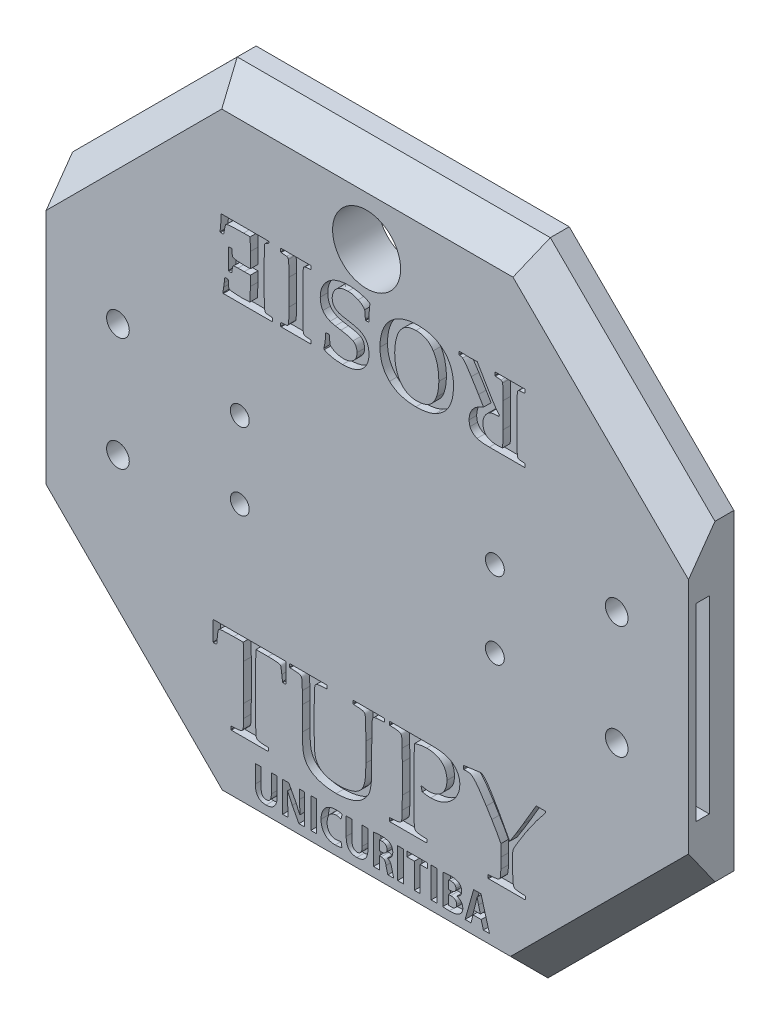
from build123d import *

# Parameters (mm, degrees)
ESBO_O1_R                = 3
RESSALTO_EXTRUS_O1_DEPTH = 12
ESBO_O11_R               = 2.5
CORTE_EXTRUS_O5_DEPTH    = 124.323043546
CORTE_EXTRUS_O3_DEPTH    = 2
ESBO_O9_W                = 1.532430111
ESBO_O9_H                = 8
CORTE_EXTRUS_O4_DEPTH    = 2
CHANFRO1_SIZE            = 7
CHANFRO4_SIZE            = 7
ESBO_O14_W               = 3.5
ESBO_O14_H               = 50
CORTE_EXTRUS_O6_DEPTH    = 5
ESBO_O15_W               = 3.5
ESBO_O15_H               = 50
CORTE_EXTRUS_O7_DEPTH    = 5
ESBO_O16_R               = 9
CORTE_EXTRUS_O8_DEPTH    = 124.323043617


with BuildPart() as part:
    # Esboço1 → Ressalto-extrusão1 (new body)
    with BuildSketch(Plane.XY):
        Polygon((43.563107436, -85.802132067), (87.764270648, -41.673487712), (87.764270648, 40.963953393), (44.193059593, 84.197867933), (-38.663162561, 84.192920715), (-82.235729352, 40.625585711), (-82.235729352, -42.010235185), (-38.515679862, -85.802132067), align=None)
        with Locations((68.764270648, 14.197867933)):
            Circle(ESBO_O1_R, mode=Mode.SUBTRACT)
        with Locations((68.764270648, -15.802132067)):
            Circle(ESBO_O1_R, mode=Mode.SUBTRACT)
        with Locations((-63.235729352, 14.197867933)):
            Circle(ESBO_O1_R, mode=Mode.SUBTRACT)
        with Locations((-63.235729352, -15.802132067)):
            Circle(ESBO_O1_R, mode=Mode.SUBTRACT)
    extrude(amount=RESSALTO_EXTRUS_O1_DEPTH)

    # Esboço11 → Corte-extrusão5 (cut, through all)
    with BuildSketch(Plane.XY.offset(12)):
        with Locations((-30.984364187, 9.347867933)):
            Circle(ESBO_O11_R)
        with Locations((-30.984364187, -10.952132067)):
            Circle(ESBO_O11_R)
        with Locations((36.514270648, 8.918571431)):
            Circle(ESBO_O11_R)
        with Locations((36.514270648, -11.381428569)):
            Circle(ESBO_O11_R)
    extrude(amount=-CORTE_EXTRUS_O5_DEPTH, mode=Mode.SUBTRACT)

    # Esboço8 → Corte-extrusão3 (cut)
    with BuildSketch(Plane.XY.offset(12)):
        with BuildLine():
            Line((-18.903215316, -40.906183626), (-18.757522749, -41.051876193))
            add(Edge.make_bspline(
                [(-18.757522749, -41.051876193), (-18.757522749, -41.182999504), (-18.757522749, -41.466290608), (-18.757522749, -41.924412792), (-18.757522749, -42.448906036), (-18.757522749, -43.041389144), (-18.757522749, -43.701862117), (-18.757522749, -44.430324955), (-18.757522749, -45.225158851), (-18.757522749, -45.777171801), (-18.757522749, -46.063700518)],
                knots=[0, 0, 0, 0, 0.627906977, 1.356589147, 2.19379845, 3.139534884, 4.19379845, 5.356589147, 6.627906977, 8, 8, 8, 8], degree=3))
            Line((-18.757522749, -46.063700518), (-18.874076803, -46.18996741))
            Line((-18.874076803, -46.18996741), (-19.573401127, -46.18996741))
            Line((-19.573401127, -46.18996741), (-19.689955181, -46.034562004))
            Line((-19.689955181, -46.034562004), (-19.869642681, -44.43680018))
            add(Edge.make_bspline(
                [(-19.869642681, -44.43680018), (-19.8897319, -44.244044943), (-19.925724084, -43.898701398), (-19.985397498, -43.444177158), (-20.029539119, -43.112783183), (-20.083104078, -42.848490382), (-20.159664754, -42.628209922), (-20.297585796, -42.457527146), (-20.484451223, -42.376840765), (-20.715347842, -42.324038847), (-21.041126459, -42.280714657), (-21.614585047, -42.212520132), (-22.447432756, -42.157174178), (-23.141168978, -42.152102221), (-23.507100451, -42.149426869)],
                knots=[0, 0, 0, 0, 1.320798869, 2.366365614, 3.1247136, 3.598640957, 4.203071764, 4.703365595, 5.034002831, 5.569213247, 6.316646856, 7.27192179, 9.506036776, 12, 12, 12, 12], degree=3))
            Line((-23.507100451, -42.149426869), (-26.7026241, -42.149426869))
            add(Edge.make_bspline(
                [(-26.7026241, -42.149426869), (-26.714708238, -42.444023752), (-26.737545759, -43.000775273), (-26.758419242, -43.787741161), (-26.784667015, -44.475615301), (-26.803438122, -45.064879567), (-26.819699795, -45.55534132), (-26.825798699, -45.94722162), (-26.840332502, -46.240066354), (-26.839097619, -46.402022436), (-26.83860383, -46.466783288)],
                knots=[0, 0, 0, 0, 1.638143172, 3.095887136, 4.373846033, 5.462731059, 6.371539501, 7.100286614, 7.640234534, 8, 8, 8, 8], degree=3))
            Line((-26.83860383, -46.466783288), (-26.83860383, -56.111631261))
            Line((-26.83860383, -56.111631261), (-26.804608897, -59.336293423))
            add(Edge.make_bspline(
                [(-26.804608897, -59.336293423), (-26.803511462, -59.485232695), (-26.801411795, -59.770190502), (-26.790251464, -60.176459791), (-26.781199782, -60.540714291), (-26.770642937, -60.862815782), (-26.763365869, -61.144703709), (-26.746912136, -61.385716838), (-26.735045835, -61.586921899), (-26.708757402, -61.791017298), (-26.677298767, -61.999106055), (-26.615765957, -62.203849693), (-26.558741157, -62.368192673), (-26.476062124, -62.492338688), (-26.361851162, -62.577798003), (-26.22450797, -62.657680774), (-26.045103975, -62.720444528), (-25.871552114, -62.781034671), (-25.691553352, -62.817487946), (-25.510259834, -62.846237521), (-25.284697402, -62.868652863), (-25.019200844, -62.892618385), (-24.71017976, -62.918508259), (-24.358606845, -62.935323684), (-23.963665632, -62.955586958), (-23.686798809, -62.967488113), (-23.541095384, -62.973751193)],
                knots=[0, 0, 0, 0, 1.725548782, 3.301403262, 4.708517588, 5.946906357, 7.035334598, 7.974763876, 8.74576873, 9.369209069, 10.358961005, 11.17818553, 11.843388349, 12.36885915, 12.875587486, 13.480413455, 14.204846366, 15.070825365, 15.607882742, 16.329396502, 17.197201394, 18.232972233, 19.418243593, 20.78940195, 22.310396582, 24, 24, 24, 24], degree=3))
            Line((-23.541095384, -62.973751193), (-23.419684911, -63.061166734))
            Line((-23.419684911, -63.061166734), (-23.419684911, -63.789629572))
            Line((-23.419684911, -63.789629572), (-23.536238965, -63.906183626))
            add(Edge.make_bspline(
                [(-23.536238965, -63.906183626), (-23.877807096, -63.906183626), (-24.522092006, -63.906183626), (-25.428623537, -63.906183626), (-26.215363402, -63.906183626), (-26.8823116, -63.906183626), (-27.429468132, -63.906183626), (-27.856832997, -63.906183626), (-28.164406195, -63.906183626), (-28.329524438, -63.906183626), (-28.392657884, -63.906183626)],
                knots=[0, 0, 0, 0, 1.688, 3.184, 4.48, 5.576, 6.48, 7.184, 7.688, 8, 8, 8, 8], degree=3))
            add(Edge.make_bspline(
                [(-28.392657884, -63.906183626), (-28.457410136, -63.906183626), (-28.625765992, -63.906183626), (-28.938195609, -63.906183626), (-29.36717928, -63.906183626), (-29.914335812, -63.906183626), (-30.576427591, -63.906183626), (-31.356692231, -63.906183626), (-32.253510924, -63.906183626), (-32.891320609, -63.906183626), (-33.229651127, -63.906183626)],
                knots=[0, 0, 0, 0, 0.321285141, 0.835341365, 1.550200803, 2.449799197, 3.550200803, 4.835341365, 6.321285141, 8, 8, 8, 8], degree=3))
            Line((-33.229651127, -63.906183626), (-33.365630857, -63.789629572))
            Line((-33.365630857, -63.789629572), (-33.365630857, -63.061166734))
            Line((-33.365630857, -63.061166734), (-33.229651127, -62.973751193))
            add(Edge.make_bspline(
                [(-33.229651127, -62.973751193), (-32.983460758, -62.964498962), (-32.537729442, -62.94774766), (-31.937885171, -62.897539607), (-31.473409318, -62.867672288), (-31.128233338, -62.816740299), (-30.874049347, -62.761257732), (-30.674454104, -62.704458745), (-30.51956245, -62.637644665), (-30.393024578, -62.561885344), (-30.300715104, -62.448119083), (-30.224337981, -62.299059343), (-30.159325998, -62.106736778), (-30.106115313, -61.91516037), (-30.069482067, -61.724849604), (-30.045363273, -61.536749593), (-30.028763615, -61.309665669), (-30.00594936, -61.042891294), (-30.000488688, -60.736522121), (-29.990118756, -60.391780493), (-29.977960279, -60.008168836), (-29.979762485, -59.739386447), (-29.98070687, -59.598540045)],
                knots=[0, 0, 0, 0, 2.494368279, 4.516090787, 6.095268213, 7.205761577, 8.045009837, 8.729599252, 9.302180148, 9.752314972, 10.205721383, 10.763081458, 11.442350914, 12.257559973, 12.77517219, 13.403473315, 14.176726908, 15.080720078, 16.113995791, 17.278356453, 18.573813925, 20, 20, 20, 20], degree=3))
            Line((-29.98070687, -59.598540045), (-29.946711938, -56.111631261))
            Line((-29.946711938, -56.111631261), (-29.946711938, -46.466783288))
            add(Edge.make_bspline(
                [(-29.946711938, -46.466783288), (-29.946379039, -46.424687363), (-29.945405437, -46.301572998), (-29.960441831, -46.057339783), (-29.965622359, -45.694554149), (-29.982327145, -45.213824614), (-30.000876837, -44.614841407), (-30.027127825, -43.897823079), (-30.047964281, -43.06230546), (-30.070622494, -42.466689165), (-30.082691668, -42.149426869)],
                knots=[0, 0, 0, 0, 0.23384997, 0.683921077, 1.358728102, 2.24956557, 3.35644065, 4.688346065, 6.236007073, 8, 8, 8, 8], degree=3))
            Line((-30.082691668, -42.149426869), (-32.603173087, -42.149426869))
            add(Edge.make_bspline(
                [(-32.603173087, -42.149426869), (-32.854101317, -42.150108411), (-33.338195701, -42.151423251), (-34.037481742, -42.168444901), (-34.683709894, -42.184043439), (-35.265204425, -42.217860433), (-35.76215587, -42.259666438), (-36.154044057, -42.326377509), (-36.433346754, -42.418700435), (-36.5973902, -42.542868052), (-36.654398325, -42.680170983), (-36.697268152, -42.811508972), (-36.742011137, -42.98316904), (-36.775914606, -43.196891557), (-36.823441043, -43.448314848), (-36.859349859, -43.742120942), (-36.898635396, -44.075535535), (-36.92251337, -44.312109082), (-36.935098762, -44.43680018)],
                knots=[0, 0, 0, 0, 2.015193879, 3.887741273, 5.617653484, 7.206381784, 8.564719821, 9.622922947, 10.388326331, 10.922791554, 11.196121512, 11.566135896, 12.035973408, 12.61739492, 13.303496942, 14.090459067, 14.993536018, 16, 16, 16, 16], degree=3))
            Line((-36.935098762, -44.43680018), (-37.095360587, -46.034562004))
            Line((-37.095360587, -46.034562004), (-37.226483897, -46.18996741))
            Line((-37.226483897, -46.18996741), (-37.911238965, -46.18996741))
            Line((-37.911238965, -46.18996741), (-38.027793019, -46.063700518))
            add(Edge.make_bspline(
                [(-38.027793019, -46.063700518), (-38.027793019, -45.757746126), (-38.027793019, -45.171738243), (-38.027793019, -44.336434189), (-38.027793019, -43.583689256), (-38.027793019, -42.916741058), (-38.027793019, -42.330733175), (-38.027793019, -41.830522027), (-38.027793019, -41.41287), (-38.027793019, -41.163573828), (-38.027793019, -41.051876193)],
                knots=[0, 0, 0, 0, 1.465116279, 2.80620155, 4, 5.069767442, 6, 6.80620155, 7.465116279, 8, 8, 8, 8], degree=3))
            Line((-38.027793019, -41.051876193), (-37.882100451, -40.906183626))
            add(Edge.make_bspline(
                [(-37.882100451, -40.906183626), (-37.624710249, -40.906183626), (-37.071078492, -40.906183626), (-36.180735024, -40.906183626), (-35.172218695, -40.906183626), (-34.045529506, -40.906183626), (-32.802286262, -40.906183626), (-31.440870159, -40.906183626), (-29.961281195, -40.906183626), (-28.934957997, -40.906183626), (-28.402370722, -40.906183626)],
                knots=[0, 0, 0, 0, 0.651639344, 1.401639344, 2.254098361, 3.204918033, 4.254098361, 5.401639344, 6.651639344, 8, 8, 8, 8], degree=3))
            add(Edge.make_bspline(
                [(-28.402370722, -40.906183626), (-27.860070609, -40.906183626), (-26.815940542, -40.906183626), (-25.313688289, -40.906183626), (-23.936084123, -40.906183626), (-22.686365654, -40.906183626), (-21.561295271, -40.906183626), (-20.564110587, -40.906183626), (-19.691573987, -40.906183626), (-19.152511487, -40.906183626), (-18.903215316, -40.906183626)],
                knots=[0, 0, 0, 0, 1.370143149, 2.63803681, 3.795501022, 4.850715746, 5.795501022, 6.63803681, 7.370143149, 8, 8, 8, 8], degree=3))
        make_face()
        with BuildLine():
            Line((-17.825090316, -41.008168423), (-17.689110587, -40.906183626))
            add(Edge.make_bspline(
                [(-17.689110587, -40.906183626), (-17.3588741, -40.906183626), (-16.735633672, -40.906183626), (-15.855003042, -40.906183626), (-15.08445124, -40.906183626), (-14.425597073, -40.906183626), (-13.878440542, -40.906183626), (-13.441362839, -40.906183626), (-13.114363965, -40.906183626), (-12.933057659, -40.906183626), (-12.861830181, -40.906183626)],
                knots=[0, 0, 0, 0, 1.641851107, 3.098591549, 4.378269618, 5.472837022, 6.374245473, 7.098591549, 7.645875252, 8, 8, 8, 8], degree=3))
            add(Edge.make_bspline(
                [(-12.861830181, -40.906183626), (-12.795459123, -40.906183626), (-12.622246848, -40.906183626), (-12.304960812, -40.906183626), (-11.871120722, -40.906183626), (-11.32396419, -40.906183626), (-10.660253605, -40.906183626), (-9.881607771, -40.906183626), (-8.986407884, -40.906183626), (-8.351835812, -40.906183626), (-8.0151241, -40.906183626)],
                knots=[0, 0, 0, 0, 0.328657315, 0.857715431, 1.571142285, 2.476953908, 3.567134269, 4.857715431, 6.332665331, 8, 8, 8, 8], degree=3))
            Line((-8.0151241, -40.906183626), (-7.87914437, -41.008168423))
            Line((-7.87914437, -41.008168423), (-7.87914437, -41.736631261))
            Line((-7.87914437, -41.736631261), (-8.0151241, -41.838616058))
            add(Edge.make_bspline(
                [(-8.0151241, -41.838616058), (-8.201324408, -41.844273013), (-8.551158472, -41.854901328), (-9.043059547, -41.882060884), (-9.467836955, -41.901143185), (-9.828702171, -41.937842806), (-10.134092777, -41.973697118), (-10.391977641, -42.024404975), (-10.604345761, -42.094334587), (-10.786449319, -42.172093679), (-10.928193193, -42.308246141), (-11.040266708, -42.49303891), (-11.117933404, -42.739520879), (-11.181352428, -43.041903485), (-11.213248111, -43.406869125), (-11.243515783, -43.834170142), (-11.262877919, -44.324940807), (-11.263657207, -44.674750485), (-11.264068357, -44.859308626)],
                knots=[0, 0, 0, 0, 1.597167084, 3.000765447, 4.224176836, 5.242065687, 6.109760969, 6.861078926, 7.488756504, 8.028830039, 8.539569355, 9.144266701, 9.864156631, 10.743431253, 11.790337824, 13.000767514, 14.41761733, 16, 16, 16, 16], degree=3))
            Line((-11.264068357, -44.859308626), (-11.298063289, -48.61332045))
            Line((-11.298063289, -48.61332045), (-11.298063289, -53.799975855))
            add(Edge.make_bspline(
                [(-11.298063289, -53.799975855), (-11.298392454, -54.007182973), (-11.299025077, -54.405416011), (-11.294661837, -54.981748536), (-11.283282656, -55.515907377), (-11.275393412, -56.008102646), (-11.261156373, -56.458206499), (-11.240266909, -56.864394248), (-11.222880594, -57.228875263), (-11.190755544, -57.650350659), (-11.138131234, -58.128737133), (-11.033670408, -58.658293064), (-10.910724486, -59.144020241), (-10.749918587, -59.585800858), (-10.550414406, -59.990008227), (-10.300999653, -60.358240816), (-10.016969933, -60.703778922), (-9.679928795, -61.021705047), (-9.277014544, -61.308042693), (-8.799466494, -61.562251783), (-8.245225953, -61.788802931), (-7.622744588, -61.991712292), (-6.939095067, -62.154169995), (-6.205368884, -62.270499029), (-5.427915619, -62.337674037), (-4.894196693, -62.347229303), (-4.620487276, -62.352129572)],
                knots=[0, 0, 0, 0, 1.151108831, 2.21232539, 3.201723038, 4.119189205, 4.946988437, 5.703259603, 6.37869601, 6.973937291, 8.051489363, 9.049757061, 9.970259382, 10.832325432, 11.656796224, 12.467417692, 13.297607086, 14.137385406, 15.033310444, 16.035257547, 17.13586723, 18.355907953, 19.66901465, 21.03512783, 22.479511601, 24, 24, 24, 24], degree=3))
            add(Edge.make_bspline(
                [(-4.620487276, -62.352129572), (-4.328767031, -62.347696011), (-3.751742157, -62.338926394), (-2.903821864, -62.234269555), (-2.081878852, -62.089623996), (-1.30242595, -61.870771731), (-0.577262175, -61.602966804), (0.06415727, -61.266553841), (0.617740626, -60.877433323), (1.078706236, -60.422568723), (1.454997203, -59.89941531), (1.75555536, -59.307648499), (1.983888232, -58.642077945), (2.112858135, -58.036956462), (2.185978612, -57.507605376), (2.240738139, -57.065879889), (2.283740913, -56.584807827), (2.315701969, -56.066471878), (2.346308477, -55.51293422), (2.365281418, -54.921930273), (2.373651387, -54.293736198), (2.376269216, -53.861492232), (2.377612386, -53.639714031)],
                knots=[0, 0, 0, 0, 1.324418483, 2.619709883, 3.876004318, 5.112426563, 6.29245309, 7.381262019, 8.393417963, 9.355417055, 10.308606343, 11.308425179, 12.359632269, 13.496263702, 14.112974987, 14.787041769, 15.518069769, 16.306607973, 17.146101057, 18.03639646, 18.992503089, 20, 20, 20, 20], degree=3))
            Line((2.377612386, -53.639714031), (2.377612386, -48.61332045))
            add(Edge.make_bspline(
                [(2.377612386, -48.61332045), (2.375795258, -48.380214316), (2.371858161, -47.875152767), (2.370009954, -47.059207674), (2.351711378, -46.125215022), (2.340028582, -45.286569452), (2.319731078, -44.603526418), (2.30696875, -44.13556055), (2.287502961, -43.725920946), (2.264488654, -43.376094373), (2.236493605, -43.084304554), (2.201282877, -42.853094004), (2.172709588, -42.67791153), (2.122008722, -42.525099189), (2.029314555, -42.387368345), (1.900665698, -42.240953414), (1.722105451, -42.135583837), (1.55537387, -42.044926442), (1.378028464, -41.999793592), (1.196098009, -41.957560004), (0.964376085, -41.934990232), (0.684901101, -41.902534132), (0.355905764, -41.880419452), (-0.021303771, -41.861146902), (-0.447122206, -41.846621431), (-0.746674075, -41.841387908), (-0.905326803, -41.838616058)],
                knots=[0, 0, 0, 0, 1.798976234, 3.897768415, 6.296638336, 9.007990729, 10.370198613, 11.570072632, 12.620639229, 13.534734887, 14.27559915, 14.881586315, 15.339742553, 15.643956982, 16.115376389, 16.610373071, 17.133572495, 17.70345917, 18.067248861, 18.540155659, 19.144466508, 19.860478258, 20.712267666, 21.687970081, 22.775471325, 24, 24, 24, 24], degree=3))
            Line((-0.905326803, -41.838616058), (-1.041306533, -41.722062004))
            Line((-1.041306533, -41.722062004), (-1.041306533, -41.037306937))
            Line((-1.041306533, -41.037306937), (-0.905326803, -40.906183626))
            add(Edge.make_bspline(
                [(-0.905326803, -40.906183626), (-0.503862839, -40.906183626), (0.256976125, -40.906183626), (1.335101125, -40.906183626), (2.286959233, -40.906183626), (2.879442341, -40.906183626), (3.154639413, -40.906183626)],
                knots=[0, 0, 0, 0, 1.186602871, 2.248803828, 3.186602871, 4, 4, 4, 4], degree=3))
            add(Edge.make_bspline(
                [(3.154639413, -40.906183626), (3.271193467, -40.906183626), (3.518870832, -40.906183626), (3.912240765, -40.906183626), (4.349318467, -40.906183626), (4.831722747, -40.906183626), (5.359453603, -40.906183626), (5.932511035, -40.906183626), (6.549276238, -40.906183626), (6.975022296, -40.906183626), (7.195179954, -40.906183626)],
                knots=[0, 0, 0, 0, 0.692307692, 1.471153846, 2.336538462, 3.288461538, 4.336538462, 5.471153846, 6.692307692, 8, 8, 8, 8], degree=3))
            Line((7.195179954, -40.906183626), (7.350585359, -41.02273768))
            Line((7.350585359, -41.02273768), (7.350585359, -41.722062004))
            Line((7.350585359, -41.722062004), (7.195179954, -41.838616058))
            add(Edge.make_bspline(
                [(7.195179954, -41.838616058), (6.949059359, -41.843638835), (6.505224296, -41.852696527), (5.909627724, -41.883909051), (5.453628444, -41.911517659), (5.120036825, -41.957517334), (4.873753759, -42.005974604), (4.68234011, -42.070428646), (4.525461436, -42.140392389), (4.359417382, -42.254626981), (4.209215591, -42.474914835), (4.126435395, -42.714224994), (4.082226493, -42.920562865), (4.066373601, -43.081769658), (4.045206528, -43.283829243), (4.032716685, -43.531863068), (4.018357255, -43.823226485), (4.002411366, -44.159859797), (3.994692753, -44.538786443), (3.988403237, -44.805891334), (3.985087049, -44.946724166)],
                knots=[0, 0, 0, 0, 2.350786194, 4.239228095, 5.696524631, 6.711034391, 7.453935801, 8.0895046, 8.635891698, 9.090594123, 9.996575691, 11.116677511, 11.495692558, 12.009618281, 12.661891005, 13.436298499, 14.38051945, 15.448291149, 16.654594512, 18, 18, 18, 18], degree=3))
            Line((3.985087049, -44.946724166), (3.93166644, -48.632746126))
            Line((3.93166644, -48.632746126), (3.93166644, -53.610575518))
            add(Edge.make_bspline(
                [(3.93166644, -53.610575518), (3.930293423, -53.851777759), (3.927621006, -54.321249604), (3.919647404, -55.006113599), (3.898918242, -55.651995612), (3.874867564, -56.259079819), (3.847067142, -56.82750223), (3.809373863, -57.355509928), (3.758613376, -57.844123865), (3.692946941, -58.43293428), (3.570920992, -59.111106232), (3.354115525, -59.861965097), (3.063603221, -60.5371157), (2.699262416, -61.135597127), (2.278670609, -61.664247224), (1.833849944, -62.155003688), (1.341908897, -62.592302548), (0.816391413, -62.996915921), (0.227901597, -63.352472118), (-0.432215043, -63.654648475), (-1.165261325, -63.924289227), (-1.967352089, -64.140343854), (-2.813990917, -64.314676393), (-3.687239204, -64.432226518), (-4.575164606, -64.515749299), (-5.173920804, -64.52376947), (-5.475217006, -64.527805247)],
                knots=[0, 0, 0, 0, 1.025052813, 1.995144962, 2.910518088, 3.771130021, 4.577076809, 5.328947697, 6.020318253, 6.664561669, 7.846576921, 8.943705494, 9.978911459, 10.960521697, 11.911422204, 12.846210117, 13.771737942, 14.704600023, 15.661429529, 16.686297648, 17.78538717, 18.97703248, 20.212874999, 21.456238663, 22.719970448, 24, 24, 24, 24], degree=3))
            add(Edge.make_bspline(
                [(-5.475217006, -64.527805247), (-5.84446302, -64.520672633), (-6.561481481, -64.506822203), (-7.604016643, -64.41739544), (-8.578527949, -64.254712135), (-9.484911891, -64.04258717), (-10.309110455, -63.763171824), (-11.049432952, -63.452390308), (-11.699423621, -63.0970266), (-12.254091861, -62.69845876), (-12.723299808, -62.270304122), (-13.12259363, -61.835169887), (-13.454174267, -61.389007661), (-13.717627703, -60.924294163), (-13.916064867, -60.428917017), (-14.074956021, -59.901731001), (-14.203206897, -59.337621911), (-14.269992877, -58.834175675), (-14.304769653, -58.395831431), (-14.337653671, -58.020672292), (-14.352367752, -57.604135771), (-14.374339615, -57.14619695), (-14.388170274, -56.647515744), (-14.395980911, -56.106773163), (-14.40900561, -55.525673941), (-14.407136193, -55.124167443), (-14.406171397, -54.916952207)],
                knots=[0, 0, 0, 0, 1.710859136, 3.322222952, 4.842552045, 6.285133903, 7.629936548, 8.869836635, 10.001179269, 11.054421527, 12.026128889, 12.939311269, 13.786870911, 14.596236184, 15.406851551, 16.25384685, 17.145460348, 18.084188884, 18.603657936, 19.182926611, 19.828644065, 20.534304102, 21.307155827, 22.139816943, 23.039970032, 24, 24, 24, 24], degree=3))
            Line((-14.406171397, -54.916952207), (-14.406171397, -48.632746126))
            Line((-14.406171397, -48.632746126), (-14.44016633, -45.442078896))
            add(Edge.make_bspline(
                [(-14.44016633, -45.442078896), (-14.441269789, -45.293140227), (-14.443368989, -45.00980191), (-14.454361633, -44.60514189), (-14.464371837, -44.240928945), (-14.471825734, -43.91862485), (-14.487700608, -43.638655851), (-14.502629231, -43.400744543), (-14.514406105, -43.202773944), (-14.540624658, -43.001812213), (-14.575189936, -42.79824776), (-14.62669058, -42.594435256), (-14.687202554, -42.433034338), (-14.770080634, -42.310494658), (-14.881090893, -42.219368568), (-15.021853273, -42.139675608), (-15.202352777, -42.077024203), (-15.378878231, -42.022824929), (-15.556042698, -41.98422083), (-15.736642025, -41.963012609), (-15.958381083, -41.938473991), (-16.222341288, -41.914785516), (-16.528124063, -41.889141167), (-16.87807522, -41.872248962), (-17.269675434, -41.850915321), (-17.545009666, -41.842841586), (-17.689110587, -41.838616058)],
                knots=[0, 0, 0, 0, 1.736418599, 3.303332332, 4.719310547, 5.984364818, 7.06161478, 7.98812341, 8.763985086, 9.372621058, 10.350016557, 11.169417812, 11.821288074, 12.350068994, 12.872070391, 13.480706364, 14.227323784, 15.093222305, 15.633662788, 16.338310968, 17.211582457, 18.235083901, 19.427821687, 20.788773096, 22.319348988, 24, 24, 24, 24], degree=3))
            Line((-17.689110587, -41.838616058), (-17.825090316, -41.736631261))
            Line((-17.825090316, -41.736631261), (-17.825090316, -41.008168423))
        make_face()
        with BuildLine():
            add(Edge.make_bspline(
                [(8.724951913, -40.906183626), (9.053569594, -40.906183626), (9.680047634, -40.906183626), (10.573628715, -40.906183626), (11.373319031, -40.906183626), (12.07911858, -40.906183626), (12.691027364, -40.906183626), (13.209045382, -40.906183626), (13.633172634, -40.906183626), (13.884087612, -40.906183626), (13.99416644, -40.906183626)],
                knots=[0, 0, 0, 0, 1.496774194, 2.853456221, 4.070046083, 5.139170507, 6.068202765, 6.857142857, 7.498617512, 8, 8, 8, 8], degree=3))
            add(Edge.make_bspline(
                [(13.99416644, -40.906183626), (14.259650675, -40.906183626), (14.8051884, -40.906183626), (15.646967679, -40.906183626), (16.535692341, -40.906183626), (17.144363513, -40.906183626), (17.45679313, -40.906183626)],
                knots=[0, 0, 0, 0, 0.920056101, 1.890603086, 2.917251052, 4, 4, 4, 4], degree=3))
            add(Edge.make_bspline(
                [(17.45679313, -40.906183626), (17.61867376, -40.906183626), (17.926246958, -40.906183626), (18.363324661, -40.906183626), (18.751838175, -40.906183626), (19.090168693, -40.906183626), (19.379935022, -40.906183626), (19.619518355, -40.906183626), (19.812156305, -40.906183626), (19.92385394, -40.906183626), (19.97241813, -40.906183626)],
                knots=[0, 0, 0, 0, 1.544401544, 2.934362934, 4.16988417, 5.250965251, 6.162162162, 6.934362934, 7.536679537, 8, 8, 8, 8], degree=3))
            add(Edge.make_bspline(
                [(19.97241813, -40.906183626), (20.338418741, -40.91148693), (21.039183718, -40.921640929), (22.041250478, -41.005704826), (22.943387295, -41.157352237), (23.757398258, -41.355457438), (24.49440034, -41.63794762), (25.15421232, -42.026636104), (25.751923287, -42.509446919), (26.272202049, -43.086044496), (26.710634535, -43.7387342), (27.018174652, -44.472510366), (27.207935582, -45.268993238), (27.230761173, -45.823028969), (27.242477251, -46.107408288)],
                knots=[0, 0, 0, 0, 1.299982056, 2.489017412, 3.567618538, 4.546640732, 5.460672635, 6.360082001, 7.255419996, 8.179471302, 9.109247766, 10.034157424, 10.990958629, 12, 12, 12, 12], degree=3))
            add(Edge.make_bspline(
                [(27.242477251, -46.107408288), (27.233760846, -46.349152596), (27.216384944, -46.831062911), (27.085132795, -47.54708971), (26.870215004, -48.251197247), (26.56828577, -48.935067135), (26.198528657, -49.592286193), (25.745602445, -50.195220616), (25.233574082, -50.755987932), (24.654993436, -51.2505932), (24.044844754, -51.689823564), (23.426529763, -52.070612894), (22.799299976, -52.377842215), (22.169759095, -52.624983043), (21.528730557, -52.801584753), (20.880228473, -52.935210682), (20.218858593, -53.014817569), (19.773514779, -53.023463943), (19.549909684, -53.027805247)],
                knots=[0, 0, 0, 0, 1.012059498, 2.017511454, 3.038389529, 4.088915882, 5.142631679, 6.189475962, 7.240286699, 8.316918139, 9.370699371, 10.386974197, 11.354234081, 12.292252296, 13.215177847, 14.135309974, 15.063747653, 16, 16, 16, 16], degree=3))
            add(Edge.make_bspline(
                [(19.549909684, -53.027805247), (19.376593216, -53.025148839), (19.019598461, -53.019677207), (18.470018643, -52.967953588), (17.891776675, -52.884961647), (17.498597894, -52.809299919), (17.296531305, -52.770415045)],
                knots=[0, 0, 0, 0, 0.915299613, 1.885320911, 2.913201804, 4, 4, 4, 4], degree=3))
            Line((17.296531305, -52.770415045), (16.985720494, -51.658295112))
            Line((16.985720494, -51.658295112), (17.136269481, -51.473751193))
            add(Edge.make_bspline(
                [(17.136269481, -51.473751193), (17.330108661, -51.52102605), (17.696728104, -51.610439767), (18.221879228, -51.707382851), (18.688767923, -51.771067885), (18.98154251, -51.780278765), (19.1176884, -51.784562004)],
                knots=[0, 0, 0, 0, 1.190846202, 2.252317469, 3.187293554, 4, 4, 4, 4], degree=3))
            add(Edge.make_bspline(
                [(19.1176884, -51.784562004), (19.291180482, -51.781990624), (19.629886491, -51.776970557), (20.123465742, -51.70391695), (20.592494537, -51.599469868), (21.03623364, -51.449584851), (21.450811565, -51.251757354), (21.844468894, -51.020755154), (22.202734608, -50.733955411), (22.538305432, -50.415782433), (22.837596721, -50.061169021), (23.103276523, -49.680201196), (23.324461008, -49.271668695), (23.511949355, -48.842287374), (23.653449057, -48.387859974), (23.746631147, -47.908757071), (23.814781167, -47.40762204), (23.820593686, -47.06436717), (23.823558332, -46.889291734)],
                knots=[0, 0, 0, 0, 1.089817972, 2.127635397, 3.130062506, 4.108537921, 5.064684098, 6.014252769, 6.97121119, 7.943047035, 8.917862999, 9.883442841, 10.858205669, 11.833818333, 12.825335053, 13.843349117, 14.900010961, 16, 16, 16, 16], degree=3))
            add(Edge.make_bspline(
                [(23.823558332, -46.889291734), (23.820298405, -46.71267205), (23.813935646, -46.367943949), (23.750685306, -45.86500426), (23.640213477, -45.392187988), (23.504740572, -44.941104419), (23.311449996, -44.523215753), (23.082332443, -44.129727593), (22.80897337, -43.76602817), (22.497704679, -43.427480897), (22.141475803, -43.127006216), (21.745958203, -42.860704997), (21.302612626, -42.644546272), (20.821369193, -42.457717173), (20.295059919, -42.318344617), (19.727292309, -42.225100615), (19.119280404, -42.157811837), (18.698618835, -42.152281375), (18.481497522, -42.149426869)],
                knots=[0, 0, 0, 0, 1.043261874, 2.036249177, 2.987595427, 3.910236522, 4.813436647, 5.700901086, 6.596165755, 7.496322061, 8.412395523, 9.343524937, 10.305961518, 11.320233283, 12.389821115, 13.515704845, 14.717749696, 16, 16, 16, 16], degree=3))
            add(Edge.make_bspline(
                [(18.481497522, -42.149426869), (18.2318302, -42.155955581), (17.71738846, -42.169408051), (16.930401747, -42.284631653), (16.105703617, -42.458013748), (15.552027602, -42.622899002), (15.266548197, -42.707915045)],
                knots=[0, 0, 0, 0, 0.914395877, 1.884120852, 2.909037231, 4, 4, 4, 4], degree=3))
            add(Edge.make_bspline(
                [(15.266548197, -42.707915045), (15.254444756, -42.830882642), (15.226770927, -43.112041047), (15.200396704, -43.589956726), (15.176022443, -44.177627053), (15.15930072, -44.877105603), (15.13632824, -45.686394009), (15.131575093, -46.606016227), (15.117692738, -47.635527501), (15.119765792, -48.359161427), (15.12085563, -48.739587342)],
                knots=[0, 0, 0, 0, 0.491315542, 1.123364987, 1.902958789, 2.830306313, 3.905665503, 5.122407942, 6.487203888, 8, 8, 8, 8], degree=3))
            Line((15.12085563, -48.739587342), (15.12085563, -56.247610991))
            Line((15.12085563, -56.247610991), (15.140281305, -59.409139707))
            add(Edge.make_bspline(
                [(15.140281305, -59.409139707), (15.141955195, -59.554832133), (15.145154204, -59.833268225), (15.148851549, -60.229916311), (15.157282836, -60.586166561), (15.175466135, -60.901569764), (15.181810913, -61.177033163), (15.195893115, -61.41196676), (15.216317522, -61.606028169), (15.239000139, -61.80465669), (15.281149446, -62.006001171), (15.335499806, -62.208952388), (15.40253568, -62.368672264), (15.484557349, -62.492180428), (15.595714146, -62.583594242), (15.736380342, -62.660889787), (15.912019718, -62.73327592), (16.088807177, -62.784740828), (16.266237356, -62.822229247), (16.445921851, -62.851493342), (16.66991016, -62.873423618), (16.935400378, -62.89750607), (17.242814363, -62.923206817), (17.592757513, -62.940124449), (17.984360233, -62.961450132), (18.259694092, -62.969525047), (18.403794819, -62.973751193)],
                knots=[0, 0, 0, 0, 1.710094914, 3.26820107, 4.655712888, 5.892019882, 6.975679602, 7.889453431, 8.653239227, 9.265967004, 10.234774684, 11.064702048, 11.728339389, 12.260675255, 12.78618602, 13.398913797, 14.139909187, 15.011629065, 15.55570288, 16.267881713, 17.147024126, 18.196326895, 19.397083349, 20.76718431, 22.308050124, 24, 24, 24, 24], degree=3))
            Line((18.403794819, -62.973751193), (18.539774549, -63.061166734))
            Line((18.539774549, -63.061166734), (18.539774549, -63.789629572))
            Line((18.539774549, -63.789629572), (18.403794819, -63.906183626))
            add(Edge.make_bspline(
                [(18.403794819, -63.906183626), (18.065464301, -63.906183626), (17.42603581, -63.906183626), (16.525979503, -63.906183626), (15.744096058, -63.906183626), (15.080385472, -63.906183626), (14.53322894, -63.906183626), (14.102626463, -63.906183626), (13.790196846, -63.906183626), (13.62184099, -63.906183626), (13.557088738, -63.906183626)],
                knots=[0, 0, 0, 0, 1.675350701, 3.166332665, 4.456913828, 5.547094188, 6.452905812, 7.166332665, 7.679358717, 8, 8, 8, 8], degree=3))
            add(Edge.make_bspline(
                [(13.557088738, -63.906183626), (13.490717679, -63.906183626), (13.319124211, -63.906183626), (13.003456981, -63.906183626), (12.572854503, -63.906183626), (12.025697972, -63.906183626), (11.365224999, -63.906183626), (10.588197972, -63.906183626), (9.697854503, -63.906183626), (9.064901238, -63.906183626), (8.729808332, -63.906183626)],
                knots=[0, 0, 0, 0, 0.329979879, 0.853118712, 1.569416499, 2.47082495, 3.573440644, 4.853118712, 6.334004024, 8, 8, 8, 8], degree=3))
            Line((8.729808332, -63.906183626), (8.593828603, -63.789629572))
            Line((8.593828603, -63.789629572), (8.593828603, -63.061166734))
            Line((8.593828603, -63.061166734), (8.729808332, -62.973751193))
            add(Edge.make_bspline(
                [(8.729808332, -62.973751193), (8.974320954, -62.963662992), (9.418212822, -62.945348719), (10.016954517, -62.903995548), (10.484288542, -62.871361331), (10.832914755, -62.822342007), (11.093952955, -62.765973866), (11.296121389, -62.705283123), (11.454459315, -62.637731893), (11.581116818, -62.56192527), (11.671907924, -62.448976575), (11.751075472, -62.303077626), (11.814215538, -62.113460929), (11.864556382, -61.92500196), (11.893660869, -61.737305691), (11.919116595, -61.552999114), (11.935797686, -61.329084739), (11.956913853, -61.067062246), (11.970774779, -60.764189186), (11.978584128, -60.422511906), (11.990246195, -60.042156264), (11.992263908, -59.77661917), (11.993321846, -59.637391396)],
                knots=[0, 0, 0, 0, 2.488380929, 4.517443927, 6.103241505, 7.250963151, 8.093729668, 8.817481521, 9.392462764, 9.844484621, 10.299791781, 10.845018432, 11.527135489, 12.325653517, 12.826315515, 13.457250574, 14.217344675, 15.108710019, 16.130527355, 17.299769195, 18.584201097, 20, 20, 20, 20], degree=3))
            Line((11.993321846, -59.637391396), (12.012747522, -56.189333964))
            Line((12.012747522, -56.189333964), (12.012747522, -48.623033288))
            Line((12.012747522, -48.623033288), (11.978752589, -45.432366058))
            add(Edge.make_bspline(
                [(11.978752589, -45.432366058), (11.977646779, -45.283427426), (11.975543106, -45.000089181), (11.964624365, -44.597046378), (11.954607544, -44.236069752), (11.946835167, -43.915398363), (11.93133657, -43.635413217), (11.916547053, -43.39748718), (11.904233237, -43.201177338), (11.878323548, -43.001810217), (11.843721213, -42.798248289), (11.79222984, -42.594435154), (11.731716078, -42.433034358), (11.648838353, -42.310494654), (11.537828004, -42.219368569), (11.397065654, -42.139675608), (11.216566139, -42.077024203), (11.040040689, -42.022824929), (10.86287622, -41.98422083), (10.682276894, -41.963012609), (10.460537836, -41.938473991), (10.196577631, -41.914785516), (9.890794856, -41.889141167), (9.540843699, -41.872248962), (9.149243485, -41.850915321), (8.873909253, -41.842841586), (8.729808332, -41.838616058)],
                knots=[0, 0, 0, 0, 1.739150858, 3.308530134, 4.707840506, 5.955991189, 7.053813227, 7.981779721, 8.740011175, 9.349604838, 10.328538271, 11.149228856, 11.802124838, 12.331737796, 12.854560564, 13.464154227, 14.211946451, 15.079207466, 15.620498334, 16.32625528, 17.200900864, 18.22601279, 19.420627352, 20.783720222, 22.316704479, 24, 24, 24, 24], degree=3))
            Line((8.729808332, -41.838616058), (8.593828603, -41.736631261))
            Line((8.593828603, -41.736631261), (8.593828603, -41.008168423))
            Line((8.593828603, -41.008168423), (8.724951913, -40.906183626))
        make_face()
        with BuildLine():
            Line((28.32545867, -42.149426869), (28.174909684, -42.00859072))
            Line((28.174909684, -42.00859072), (28.174909684, -41.357830585))
            Line((28.174909684, -41.357830585), (28.32545867, -41.216994437))
            Line((28.32545867, -41.216994437), (32.982764413, -40.595372815))
            add(Edge.make_bspline(
                [(32.982764413, -40.595372815), (33.151397631, -40.720756963), (33.502163152, -40.981562258), (33.903663548, -41.395095517), (34.25682618, -41.807685304), (34.566168672, -42.246366414), (34.943221986, -42.788749373), (35.280718043, -43.32089767), (35.589952366, -43.801251168), (35.839075273, -44.212969267), (36.108362246, -44.657786134), (36.395750648, -45.137146238), (36.692720463, -45.656906076), (37.01733773, -46.205608257), (37.350190189, -46.792937063), (38.054526866, -48.045432344), (39.108807887, -49.950868029), (40.005426324, -51.670986054), (40.451936711, -52.527594099)],
                knots=[0, 0, 0, 0, 0.711691423, 1.480353734, 1.947824438, 2.55288944, 3.299087491, 4.188426435, 4.68950739, 5.236571407, 5.820338871, 6.453066987, 7.132007524, 7.850464366, 8.615195278, 9.421483531, 12.723939844, 16, 16, 16, 16], degree=3))
            Line((40.451936711, -52.527594099), (42.112831981, -49.900271464))
            Line((42.112831981, -49.900271464), (43.987409684, -46.792163355))
            Line((43.987409684, -46.792163355), (47.445179954, -40.906183626))
            add(Edge.make_bspline(
                [(47.445179954, -40.906183626), (47.652387161, -40.906183626), (48.061945157, -40.906183626), (48.471503152, -40.906183626), (48.67385394, -40.906183626)],
                knots=[0, 0, 0, 0, 1.011857708, 2, 2, 2, 2], degree=3))
            add(Edge.make_bspline(
                [(48.67385394, -40.906183626), (48.743462612, -40.906183626), (48.898868017, -40.906183626), (49.15625822, -40.906183626), (49.462212612, -40.906183626), (49.682370269, -40.906183626), (49.80054313, -40.906183626)],
                knots=[0, 0, 0, 0, 0.74137931, 1.655172414, 2.74137931, 4, 4, 4, 4], degree=3))
            Line((49.80054313, -40.906183626), (49.93166644, -40.969317072))
            Line((49.93166644, -40.969317072), (49.93166644, -41.280127883))
            add(Edge.make_bspline(
                [(49.93166644, -41.280127883), (49.858785895, -41.362652415), (49.700827424, -41.541512892), (49.446917492, -41.830689141), (49.172731728, -42.172663781), (48.866665107, -42.556203089), (48.52966785, -42.982537634), (48.173531222, -43.46180218), (47.777046343, -43.978293536), (47.371476527, -44.534932341), (46.96336616, -45.096080036), (46.567942242, -45.63410795), (46.20523109, -46.143536528), (45.868845521, -46.621322491), (45.558946438, -47.066018829), (45.276996674, -47.478659927), (45.023450495, -47.859506921), (44.710887661, -48.336552124), (44.32637497, -48.957936217), (43.821761269, -49.746348642), (43.280844179, -50.62926991), (42.800906567, -51.401573931), (42.418688286, -52.02472126), (42.161367015, -52.452145564), (41.938056271, -52.828455075), (41.751614261, -53.157935936), (41.599439891, -53.434652336), (41.476297295, -53.659989745), (41.401418634, -53.839432834), (41.30395584, -54.081356206), (41.245793097, -54.449824817), (41.234836659, -54.772909388), (41.228963738, -54.94609072)],
                knots=[0, 0, 0, 0, 0.606660283, 1.314852013, 2.120035589, 3.021307051, 4.018742036, 5.114068094, 6.311083128, 7.606261405, 8.908637298, 10.134288077, 11.285220614, 12.354264574, 13.353890631, 14.271737484, 15.107894374, 15.87481974, 17.414055326, 19.133886277, 21.032409073, 23.119087244, 24.144020316, 25.060305613, 25.868004855, 26.555041533, 27.145889925, 27.608675994, 27.968234387, 28.216704187, 29.044109273, 30, 30, 30, 30], degree=3))
            Line((41.228963738, -54.94609072), (41.228963738, -57.345161666))
            Line((41.228963738, -57.345161666), (41.248389413, -59.792796801))
            add(Edge.make_bspline(
                [(41.248389413, -59.792796801), (41.253098727, -60.011316909), (41.261751405, -60.412815825), (41.275624986, -60.962271833), (41.312497444, -61.403897862), (41.345350893, -61.750671436), (41.403546779, -62.017013803), (41.458386966, -62.228202544), (41.524317098, -62.391548405), (41.605935504, -62.516436307), (41.719110707, -62.602741801), (41.859321455, -62.675497701), (42.034477624, -62.740903863), (42.208033025, -62.794821672), (42.383688346, -62.833045486), (42.562730542, -62.853599596), (42.782496657, -62.880554885), (43.045453729, -62.895384858), (43.350855227, -62.923951839), (43.700887114, -62.939886314), (44.092462062, -62.961519704), (44.367800043, -62.969548949), (44.511902927, -62.973751193)],
                knots=[0, 0, 0, 0, 2.279698673, 4.188614758, 5.729459823, 6.902154976, 7.815995223, 8.569680655, 9.174865487, 9.647876552, 10.104016282, 10.640284494, 11.292394528, 12.050792306, 12.534233215, 13.164563041, 13.928950234, 14.843102319, 15.910043557, 17.12745714, 18.496605127, 20, 20, 20, 20], degree=3))
            Line((44.511902927, -62.973751193), (44.647882657, -63.061166734))
            Line((44.647882657, -63.061166734), (44.647882657, -63.789629572))
            Line((44.647882657, -63.789629572), (44.511902927, -63.906183626))
            add(Edge.make_bspline(
                [(44.511902927, -63.906183626), (44.490858445, -63.906183626), (44.418012161, -63.906183626), (44.265844368, -63.906183626), (44.026261035, -63.906183626), (43.699262161, -63.906183626), (43.28322894, -63.906183626), (42.779780179, -63.906183626), (42.188915877, -63.906183626), (41.766407431, -63.906183626), (41.539774549, -63.906183626)],
                knots=[0, 0, 0, 0, 0.169934641, 0.588235294, 1.22875817, 2.104575163, 3.22875817, 4.588235294, 6.169934641, 8, 8, 8, 8], degree=3))
            add(Edge.make_bspline(
                [(41.539774549, -63.906183626), (41.350374211, -63.906183626), (40.994236823, -63.906183626), (40.492406868, -63.906183626), (40.056947972, -63.906183626), (39.788226125, -63.906183626), (39.665196846, -63.906183626)],
                knots=[0, 0, 0, 0, 1.212435233, 2.279792746, 3.212435233, 4, 4, 4, 4], degree=3))
            add(Edge.make_bspline(
                [(39.665196846, -63.906183626), (39.600444594, -63.906183626), (39.432088738, -63.906183626), (39.121277927, -63.906183626), (38.693913062, -63.906183626), (38.149994143, -63.906183626), (37.487902364, -63.906183626), (36.709256531, -63.906183626), (35.812437837, -63.906183626), (35.176246958, -63.906183626), (34.83791644, -63.906183626)],
                knots=[0, 0, 0, 0, 0.32193159, 0.837022133, 1.54527163, 2.44668008, 3.541247485, 4.837022133, 6.317907445, 8, 8, 8, 8], degree=3))
            Line((34.83791644, -63.906183626), (34.701936711, -63.789629572))
            Line((34.701936711, -63.789629572), (34.701936711, -63.061166734))
            Line((34.701936711, -63.061166734), (34.83791644, -62.973751193))
            add(Edge.make_bspline(
                [(34.83791644, -62.973751193), (35.087287966, -62.963689797), (35.539276352, -62.945453416), (36.14609635, -62.904094582), (36.613565555, -62.87222281), (36.957201649, -62.822019971), (37.211829539, -62.765996281), (37.409283615, -62.705628334), (37.563965615, -62.636809455), (37.687338061, -62.561945391), (37.779724903, -62.456666798), (37.851047171, -62.318848063), (37.91922879, -62.150533244), (37.974677321, -61.930396455), (38.016414215, -61.632804014), (38.054849503, -61.23273159), (38.075485543, -60.714065352), (38.08281238, -60.330248325), (38.086860697, -60.118176869)],
                knots=[0, 0, 0, 0, 2.209506846, 4.004753285, 5.385456799, 6.356381324, 7.076160012, 7.692630523, 8.180151291, 8.573712346, 8.959364468, 9.402055403, 9.942341113, 10.564615778, 11.405857988, 12.600980857, 14.121930802, 16, 16, 16, 16], degree=3))
            Line((38.086860697, -60.118176869), (38.12085563, -57.325735991))
            Line((38.12085563, -57.325735991), (38.12085563, -54.22734072))
            add(Edge.make_bspline(
                [(38.12085563, -54.22734072), (38.082651876, -54.139627959), (37.993272385, -53.934419799), (37.822704524, -53.592770747), (37.595879393, -53.173619008), (37.320431392, -52.674200925), (36.988500602, -52.098142867), (36.609966289, -51.438855393), (36.173472981, -50.705441347), (35.864392824, -50.189944127), (35.702359008, -49.919697139)],
                knots=[0, 0, 0, 0, 0.464491151, 1.086699052, 1.853312172, 2.778629309, 3.855952296, 5.081482089, 6.469980738, 8, 8, 8, 8], degree=3))
            Line((35.702359008, -49.919697139), (34.250289751, -47.544908288))
            add(Edge.make_bspline(
                [(34.250289751, -47.544908288), (34.127466671, -47.348906833), (33.870878067, -46.939441941), (33.463909054, -46.299348675), (33.001474836, -45.620002777), (32.518425931, -44.916875776), (32.053618067, -44.244650017), (31.611904067, -43.678877374), (31.24634813, -43.219218991), (30.914447129, -42.886555471), (30.636216444, -42.636312311), (30.399035842, -42.448878692), (30.193481723, -42.317791271), (29.991640093, -42.228512115), (29.736007754, -42.196239727), (29.383328261, -42.168039083), (28.898588534, -42.150116049), (28.53102842, -42.149674064), (28.32545867, -42.149426869)],
                knots=[0, 0, 0, 0, 1.2993856, 2.714534884, 4.260629559, 5.915313748, 7.507366026, 8.849700471, 9.947671947, 10.802917853, 11.485614197, 12.049498828, 12.498695984, 12.853351478, 13.277942036, 13.93496014, 14.84506041, 16, 16, 16, 16], degree=3))
        make_face()
    extrude(amount=-CORTE_EXTRUS_O3_DEPTH, mode=Mode.SUBTRACT)

    # Esboço9 → Corte-extrusão4 (cut)
    # profile 1 of 16: a face of its own
    with BuildSketch(Plane.XY.offset(12)):
        with BuildLine():
            add(Edge.make_bspline(
                [(-36.209991674, 48.869432407), (-36.172048268, 49.18337444), (-36.093853486, 49.83035455), (-36.021768363, 50.83347296), (-35.974686182, 51.895577432), (-35.969442344, 52.623176938), (-35.966748431, 52.996966191)],
                knots=[0, 0, 0, 0, 0.917037288, 1.889854889, 2.91595643, 4, 4, 4, 4], degree=3))
            Line((-35.966748431, 52.996966191), (-35.841326133, 53.122388488))
            Line((-35.841326133, 53.122388488), (-26.681697755, 53.122388488))
            add(Edge.make_bspline(
                [(-26.681697755, 53.122388488), (-26.497998431, 53.122388488), (-26.144535593, 53.122388488), (-25.635245052, 53.122388488), (-25.166495052, 53.122388488), (-24.740819377, 53.122388488), (-24.356951133, 53.122388488), (-24.016157215, 53.122388488), (-23.715903836, 53.122388488), (-23.529670728, 53.122388488), (-23.443522079, 53.122388488)],
                knots=[0, 0, 0, 0, 1.361502347, 2.61971831, 3.774647887, 4.835680751, 5.774647887, 6.61971831, 7.361502347, 8, 8, 8, 8], degree=3))
            Line((-23.443522079, 53.122388488), (-23.318099782, 53.023570921))
            Line((-23.318099782, 53.023570921), (-23.318099782, 52.742320921))
            Line((-23.318099782, 52.742320921), (-23.378910593, 52.620699299))
            add(Edge.make_bspline(
                [(-23.378910593, 52.620699299), (-23.449829761, 52.582645635), (-23.584182927, 52.510554684), (-23.77294056, 52.410196416), (-23.93488526, 52.31720482), (-24.071791479, 52.235605037), (-24.180496666, 52.159279424), (-24.265853718, 52.097344278), (-24.33062815, 52.048577874), (-24.35388543, 52.009416226), (-24.363285593, 51.993587813)],
                knots=[0, 0, 0, 0, 1.644613989, 3.115647017, 4.367912269, 5.460102788, 6.372059643, 7.076273005, 7.626646636, 8, 8, 8, 8], degree=3))
            add(Edge.make_bspline(
                [(-24.363285593, 51.993587813), (-24.372918067, 51.967183837), (-24.396718026, 51.901944781), (-24.41412595, 51.779570255), (-24.439745518, 51.621938267), (-24.451417415, 51.423462541), (-24.466726929, 51.187928935), (-24.483943734, 50.913131846), (-24.488499202, 50.599992427), (-24.493599096, 50.378293301), (-24.496309242, 50.260479705)],
                knots=[0, 0, 0, 0, 0.386181525, 0.954178975, 1.694345954, 2.586819423, 3.688124436, 4.946166392, 6.377155884, 8, 8, 8, 8], degree=3))
            Line((-24.496309242, 50.260479705), (-24.534315998, 47.345361461))
            Line((-24.534315998, 47.345361461), (-24.534315998, 40.743587813))
            add(Edge.make_bspline(
                [(-24.534315998, 40.743587813), (-24.53340354, 40.496540808), (-24.53166281, 40.02523977), (-24.523653819, 39.352515303), (-24.514039798, 38.746833445), (-24.494414023, 38.208400855), (-24.471933019, 37.737062541), (-24.447221255, 37.333858638), (-24.41396321, 36.997866454), (-24.384207887, 36.797134475), (-24.370886944, 36.707270245)],
                knots=[0, 0, 0, 0, 1.4666452, 2.797975244, 3.994052296, 5.062718677, 5.996433479, 6.795412774, 7.460727163, 8, 8, 8, 8], degree=3))
            add(Edge.make_bspline(
                [(-24.370886944, 36.707270245), (-24.358241847, 36.648676136), (-24.333916375, 36.535958193), (-24.235054814, 36.395133314), (-24.106801425, 36.280832474), (-23.997888657, 36.243792152), (-23.941410593, 36.224584434)],
                knots=[0, 0, 0, 0, 1.040890066, 2.002368338, 2.964103382, 4, 4, 4, 4], degree=3))
            add(Edge.make_bspline(
                [(-23.941410593, 36.224584434), (-23.91988558, 36.22071506), (-23.865559471, 36.210949302), (-23.768131442, 36.195854352), (-23.636276428, 36.180915483), (-23.470250935, 36.166042871), (-23.268611298, 36.152125571), (-23.033175695, 36.131713654), (-22.763269282, 36.113296698), (-22.571907723, 36.101571798), (-22.470549106, 36.095361461)],
                knots=[0, 0, 0, 0, 0.355319326, 0.896776043, 1.601427743, 2.510818644, 3.604825199, 4.885120238, 6.350139352, 8, 8, 8, 8], degree=3))
            Line((-22.470549106, 36.095361461), (-22.345126809, 35.985141867))
            Line((-22.345126809, 35.985141867), (-22.345126809, 35.221206056))
            Line((-22.345126809, 35.221206056), (-22.470549106, 35.122388488))
            add(Edge.make_bspline(
                [(-22.470549106, 35.122388488), (-22.583302485, 35.122388488), (-22.822745052, 35.122388488), (-23.204079512, 35.122388488), (-23.628488296, 35.122388488), (-24.095971404, 35.122388488), (-24.606528836, 35.122388488), (-25.160160593, 35.122388488), (-25.756866674, 35.122388488), (-26.168606539, 35.122388488), (-26.381444377, 35.122388488)],
                knots=[0, 0, 0, 0, 0.691933916, 1.469387755, 2.340136054, 3.296404276, 4.33819242, 5.473275024, 6.693877551, 8, 8, 8, 8], degree=3))
            add(Edge.make_bspline(
                [(-26.381444377, 35.122388488), (-26.485329512, 35.122388488), (-26.703234917, 35.122388488), (-27.047829512, 35.122388488), (-27.425363296, 35.122388488), (-27.83710316, 35.122388488), (-28.280515323, 35.122388488), (-28.756866674, 35.122388488), (-29.266157215, 35.122388488), (-29.809653836, 35.122388488), (-30.387356539, 35.122388488), (-30.997998431, 35.122388488), (-31.641579512, 35.122388488), (-32.318099782, 35.122388488), (-33.027559242, 35.122388488), (-33.76995789, 35.122388488), (-34.545295728, 35.122388488), (-35.073589647, 35.122388488), (-35.34343762, 35.122388488)],
                knots=[0, 0, 0, 0, 0.556403732, 1.167090755, 1.845631891, 2.578456319, 3.372349449, 4.220525869, 5.129770992, 6.100084818, 7.131467345, 8.223918575, 9.370653096, 10.578456319, 11.847328244, 13.170483461, 14.554707379, 16, 16, 16, 16], degree=3))
            Line((-35.34343762, 35.122388488), (-35.480261944, 35.221206056))
            Line((-35.480261944, 35.221206056), (-35.263623431, 36.600851326))
            add(Edge.make_bspline(
                [(-35.263623431, 36.600851326), (-35.231590023, 36.804602432), (-35.172999334, 37.177273293), (-35.13074771, 37.552136965), (-35.111596404, 37.72205065)],
                knots=[0, 0, 0, 0, 1.093464112, 2, 2, 2, 2], degree=3))
            Line((-35.111596404, 37.72205065), (-34.993775458, 38.877456056))
            Line((-34.993775458, 38.877456056), (-34.86835316, 39.01428038))
            Line((-34.86835316, 39.01428038), (-34.146224782, 39.01428038))
            Line((-34.146224782, 39.01428038), (-34.020802485, 38.888858083))
            add(Edge.make_bspline(
                [(-34.020802485, 38.888858083), (-34.020104676, 38.754563094), (-34.018794346, 38.502387215), (-34.008438919, 38.146200915), (-33.987383615, 37.837270985), (-33.970865567, 37.572089883), (-33.945844461, 37.352139866), (-33.912000758, 37.178526379), (-33.877643081, 37.047768502), (-33.841864183, 36.981785481), (-33.826968025, 36.954314164)],
                knots=[0, 0, 0, 0, 1.647449382, 3.093540571, 4.370292737, 5.445453079, 6.353388654, 7.081842294, 7.617734964, 8, 8, 8, 8], degree=3))
            add(Edge.make_bspline(
                [(-33.826968025, 36.954314164), (-33.811165554, 36.939353584), (-33.772938083, 36.903162717), (-33.684663834, 36.870991634), (-33.57072025, 36.830619652), (-33.421857956, 36.800243706), (-33.242612978, 36.763949984), (-33.030219224, 36.736461534), (-32.786071348, 36.704265735), (-32.422315394, 36.671246317), (-31.962378201, 36.638493119), (-31.428980054, 36.607480478), (-30.93100176, 36.587476789), (-30.610345798, 36.583678818), (-30.455768701, 36.581847948)],
                knots=[0, 0, 0, 0, 0.227351111, 0.549980931, 0.972161346, 1.506515682, 2.145390578, 2.900609862, 3.761692331, 4.740750468, 6.748705497, 8.620826928, 10.371018087, 12, 12, 12, 12], degree=3))
            add(Edge.make_bspline(
                [(-30.455768701, 36.581847948), (-30.100900572, 36.58605169), (-29.386798076, 36.594510898), (-28.674376875, 36.644244596), (-28.315988296, 36.669263488)],
                knots=[0, 0, 0, 0, 0.993885701, 2, 2, 2, 2], degree=3))
            add(Edge.make_bspline(
                [(-28.315988296, 36.669263488), (-28.305437205, 36.784516449), (-28.283423008, 37.024984604), (-28.25751748, 37.401359201), (-28.234672929, 37.809328035), (-28.215931582, 38.248986926), (-28.201218554, 38.720301369), (-28.18839182, 39.223250546), (-28.187215902, 39.757952746), (-28.184407555, 40.125347045), (-28.182964647, 40.314111461)],
                knots=[0, 0, 0, 0, 0.761274411, 1.588351855, 2.48143843, 3.449023405, 4.48291639, 5.583224025, 6.758278758, 8, 8, 8, 8], degree=3))
            Line((-28.182964647, 40.314111461), (-28.182964647, 42.906172272))
            add(Edge.make_bspline(
                [(-28.182964647, 42.906172272), (-28.341326133, 42.906172272), (-28.642846404, 42.906172272), (-29.072322755, 42.906172272), (-29.454924106, 42.906172272), (-29.694366674, 42.906172272), (-29.80585316, 42.906172272)],
                knots=[0, 0, 0, 0, 1.170960187, 2.229508197, 3.175644028, 4, 4, 4, 4], degree=3))
            Line((-29.80585316, 42.906172272), (-31.462947755, 42.894770245))
            add(Edge.make_bspline(
                [(-31.462947755, 42.894770245), (-31.555450023, 42.89423537), (-31.7291316, 42.893231093), (-31.973662315, 42.880902805), (-32.185346635, 42.866148914), (-32.365712667, 42.848846765), (-32.514546272, 42.822620176), (-32.631912366, 42.791764332), (-32.724058068, 42.763487963), (-32.764740306, 42.72743888), (-32.781782215, 42.712337813)],
                knots=[0, 0, 0, 0, 1.64695743, 3.092315162, 4.358834641, 5.425087856, 6.318945988, 7.041184598, 7.598349418, 8, 8, 8, 8], degree=3))
            add(Edge.make_bspline(
                [(-32.781782215, 42.712337813), (-32.799551681, 42.688961886), (-32.841261138, 42.634092639), (-32.876650817, 42.517976082), (-32.921213587, 42.371270048), (-32.951364822, 42.184470685), (-32.982814544, 41.961677585), (-33.007869391, 41.701607351), (-33.030963252, 41.403868042), (-33.041988485, 41.193368102), (-33.047829512, 41.081847948)],
                knots=[0, 0, 0, 0, 0.41986054, 0.985519487, 1.724535249, 2.633125377, 3.700919513, 4.965771371, 6.392504797, 8, 8, 8, 8], degree=3))
            Line((-33.047829512, 41.081847948), (-33.165650458, 40.960226326))
            Line((-33.165650458, 40.960226326), (-33.902981539, 40.960226326))
            Line((-33.902981539, 40.960226326), (-34.020802485, 41.085648623))
            add(Edge.make_bspline(
                [(-34.020802485, 41.085648623), (-34.020802485, 41.535395245), (-34.020802485, 42.394347948), (-34.020802485, 43.25330065), (-34.020802485, 43.662506732)],
                knots=[0, 0, 0, 0, 1.04719764, 2, 2, 2, 2], degree=3))
            add(Edge.make_bspline(
                [(-34.020802485, 43.662506732), (-34.020802485, 44.105918894), (-34.020802485, 45.032016867), (-34.020802485, 45.95811484), (-34.020802485, 46.44080065)],
                knots=[0, 0, 0, 0, 0.957592339, 2, 2, 2, 2], degree=3))
            Line((-34.020802485, 46.44080065), (-33.91058289, 46.554820921))
            Line((-33.91058289, 46.554820921), (-33.158049106, 46.554820921))
            Line((-33.158049106, 46.554820921), (-33.047829512, 46.433199299))
            add(Edge.make_bspline(
                [(-33.047829512, 46.433199299), (-33.046647215, 46.322987078), (-33.04440465, 46.113937952), (-33.039926178, 45.817142782), (-33.019351561, 45.556215549), (-32.996987543, 45.330586189), (-32.972025928, 45.139870631), (-32.93953645, 44.984128446), (-32.899114864, 44.863183663), (-32.8298412, 44.739552708), (-32.667336275, 44.627604066), (-32.398505873, 44.541657271), (-32.032169744, 44.467335937), (-31.752195573, 44.441088487), (-31.595971404, 44.426442542)],
                knots=[0, 0, 0, 0, 1.320364419, 2.504450277, 3.554312285, 4.454290624, 5.220470587, 5.857484363, 6.356667037, 6.744462267, 7.533739376, 8.633211339, 10.121348973, 12, 12, 12, 12], degree=3))
            add(Edge.make_bspline(
                [(-31.595971404, 44.426442542), (-31.326217041, 44.408710169), (-30.770652824, 44.372190011), (-30.213897434, 44.367859541), (-29.927474782, 44.365631732)],
                knots=[0, 0, 0, 0, 0.971100567, 2, 2, 2, 2], degree=3))
            add(Edge.make_bspline(
                [(-29.927474782, 44.365631732), (-29.625954512, 44.365631732), (-29.044451133, 44.365631732), (-28.462947755, 44.365631732), (-28.182964647, 44.365631732)],
                knots=[0, 0, 0, 0, 1.037037037, 2, 2, 2, 2], degree=3))
            Line((-28.182964647, 44.365631732), (-28.182964647, 48.34873984))
            add(Edge.make_bspline(
                [(-28.182964647, 48.34873984), (-28.185001848, 48.910032537), (-28.189012694, 50.015106903), (-28.228262303, 51.119488336), (-28.247576133, 51.662929029)],
                knots=[0, 0, 0, 0, 1.015846017, 2, 2, 2, 2], degree=3))
            Line((-28.247576133, 51.662929029), (-29.965481539, 51.662929029))
            add(Edge.make_bspline(
                [(-29.965481539, 51.662929029), (-30.258142153, 51.662649063), (-30.814370267, 51.662116963), (-31.60370297, 51.646182045), (-32.303096989, 51.623829511), (-32.912827001, 51.595814888), (-33.433707894, 51.553778435), (-33.866416996, 51.507032155), (-34.211616014, 51.450742212), (-34.407546758, 51.394530873), (-34.492086269, 51.370277002)],
                knots=[0, 0, 0, 0, 1.544771069, 2.935977909, 4.167087393, 5.238385287, 6.157488019, 6.924776202, 7.536066206, 8, 8, 8, 8], degree=3))
            add(Edge.make_bspline(
                [(-34.492086269, 51.370277002), (-34.533310986, 51.352743678), (-34.610476133, 51.319924495), (-34.667133398, 51.258336991), (-34.693522079, 51.229652002)],
                knots=[0, 0, 0, 0, 1.06848024, 2, 2, 2, 2], degree=3))
            add(Edge.make_bspline(
                [(-34.693522079, 51.229652002), (-34.714912952, 51.192158906), (-34.765759559, 51.103036935), (-34.820943724, 50.933544423), (-34.883045195, 50.717407104), (-34.915306446, 50.554747794), (-34.932964647, 50.465716191)],
                knots=[0, 0, 0, 0, 0.642688873, 1.527686566, 2.646778782, 4, 4, 4, 4], degree=3))
            Line((-34.932964647, 50.465716191), (-35.237018701, 48.88463511))
            Line((-35.237018701, 48.88463511), (-35.354839647, 48.74401011))
            Line((-35.354839647, 48.74401011), (-36.080768701, 48.74401011))
            Line((-36.080768701, 48.74401011), (-36.209991674, 48.869432407))
        make_face()
    # profile 2 of 16: a face of its own
    with BuildSketch(Plane.XY.offset(12)):
        with BuildLine():
            Line((-20.155937621, 53.012289988), (-20.04191735, 53.122509582))
            add(Edge.make_bspline(
                [(-20.04191735, 53.122509582), (-19.929163972, 53.122509582), (-19.689721404, 53.122509582), (-19.308386945, 53.122509582), (-18.883978161, 53.122509582), (-18.416495053, 53.122509582), (-17.907204513, 53.122509582), (-17.354839648, 53.122509582), (-16.759400458, 53.122509582), (-16.347660594, 53.122509582), (-16.134822756, 53.122509582)],
                knots=[0, 0, 0, 0, 0.692607004, 1.470817121, 2.342412451, 3.299610895, 4.342412451, 5.470817121, 6.692607004, 8, 8, 8, 8], degree=3))
            add(Edge.make_bspline(
                [(-16.134822756, 53.122509582), (-15.92325181, 53.122509582), (-15.514045729, 53.122509582), (-14.921140323, 53.122509582), (-14.37004235, 53.122509582), (-13.862018702, 53.122509582), (-13.397069377, 53.122509582), (-12.975194377, 53.122509582), (-12.59512681, 53.122509582), (-12.355684242, 53.122509582), (-12.242930864, 53.122509582)],
                knots=[0, 0, 0, 0, 1.3046875, 2.5234375, 3.65625, 4.703125, 5.65625, 6.5234375, 7.3046875, 8, 8, 8, 8], degree=3))
            Line((-12.242930864, 53.122509582), (-12.128910594, 53.012289988))
            Line((-12.128910594, 53.012289988), (-12.128910594, 52.259756204))
            Line((-12.128910594, 52.259756204), (-12.254332891, 52.149536609))
            add(Edge.make_bspline(
                [(-12.254332891, 52.149536609), (-12.355702417, 52.14348031), (-12.54708457, 52.132046228), (-12.816763995, 52.111722332), (-13.052528424, 52.097251452), (-13.254268776, 52.083783586), (-13.419979852, 52.063993332), (-13.551384276, 52.046740983), (-13.650177254, 52.039952569), (-13.70375254, 52.025926952), (-13.725194377, 52.020313636)],
                knots=[0, 0, 0, 0, 1.649446737, 3.114098312, 4.392582563, 5.486314657, 6.397570922, 7.102045842, 7.640621866, 8, 8, 8, 8], degree=3))
            add(Edge.make_bspline(
                [(-13.725194377, 52.020313636), (-13.781450875, 52.000846894), (-13.889163817, 51.963574399), (-14.020023222, 51.853737589), (-14.11750424, 51.712506599), (-14.141958621, 51.59994259), (-14.154670729, 51.541428501)],
                knots=[0, 0, 0, 0, 1.039593861, 1.990484962, 2.955394869, 4, 4, 4, 4], degree=3))
            add(Edge.make_bspline(
                [(-14.154670729, 51.541428501), (-14.167996475, 51.452832895), (-14.197805258, 51.254650576), (-14.231025845, 50.922447921), (-14.255733014, 50.523041005), (-14.278208355, 50.055501984), (-14.297828754, 49.52086972), (-14.307440527, 48.918987662), (-14.315430797, 48.251330617), (-14.317183224, 47.783830226), (-14.318099783, 47.539317015)],
                knots=[0, 0, 0, 0, 0.536354685, 1.199788791, 1.998002783, 2.932091839, 4.002277373, 5.200955098, 6.536036614, 8, 8, 8, 8], degree=3))
            Line((-14.318099783, 47.539317015), (-14.318099783, 40.70570215))
            add(Edge.make_bspline(
                [(-14.318099783, 40.70570215), (-14.317183224, 40.461188939), (-14.315430797, 39.993688547), (-14.307440527, 39.326031503), (-14.297828754, 38.724149445), (-14.278208355, 38.18951718), (-14.255733014, 37.72197816), (-14.231025845, 37.322571244), (-14.197805258, 36.990368588), (-14.167996475, 36.79218627), (-14.154670729, 36.703590663)],
                knots=[0, 0, 0, 0, 1.463963386, 2.799044902, 3.997722627, 5.067908161, 6.001997217, 6.800211209, 7.463645315, 8, 8, 8, 8], degree=3))
            add(Edge.make_bspline(
                [(-14.154670729, 36.703590663), (-14.141958621, 36.645076575), (-14.11750424, 36.532512566), (-14.020023222, 36.391281576), (-13.889163817, 36.281444766), (-13.781450875, 36.24417227), (-13.725194377, 36.224705528)],
                knots=[0, 0, 0, 0, 1.044605131, 2.009515038, 2.960406139, 4, 4, 4, 4], degree=3))
            add(Edge.make_bspline(
                [(-13.725194377, 36.224705528), (-13.703753402, 36.219083544), (-13.650180267, 36.205036266), (-13.551362342, 36.198498945), (-13.420230582, 36.179804228), (-13.253761825, 36.167863191), (-13.052837254, 36.145517326), (-12.816697615, 36.134039017), (-12.547104681, 36.11274808), (-12.35570938, 36.101460994), (-12.254332891, 36.095482555)],
                knots=[0, 0, 0, 0, 0.359393978, 0.897993745, 1.602499721, 2.511702558, 3.60722379, 4.885764403, 6.350480547, 8, 8, 8, 8], degree=3))
            Line((-12.254332891, 36.095482555), (-12.128910594, 35.985262961))
            Line((-12.128910594, 35.985262961), (-12.128910594, 35.22132715))
            Line((-12.128910594, 35.22132715), (-12.254332891, 35.122509582))
            add(Edge.make_bspline(
                [(-12.254332891, 35.122509582), (-12.363285594, 35.122509582), (-12.596393702, 35.122509582), (-12.968859918, 35.122509582), (-13.386934242, 35.122509582), (-13.850616675, 35.122509582), (-14.361174107, 35.122509582), (-14.917339648, 35.122509582), (-15.519113296, 35.122509582), (-15.934653837, 35.122509582), (-16.150025458, 35.122509582)],
                knots=[0, 0, 0, 0, 0.671219512, 1.436097561, 2.294634146, 3.246829268, 4.292682927, 5.44, 6.673170732, 8, 8, 8, 8], degree=3))
            add(Edge.make_bspline(
                [(-16.150025458, 35.122509582), (-16.364130188, 35.122509582), (-16.778403837, 35.122509582), (-17.37637681, 35.122509582), (-17.930008567, 35.122509582), (-18.436765323, 35.122509582), (-18.899180864, 35.122509582), (-19.315988296, 35.122509582), (-19.688454513, 35.122509582), (-19.921562621, 35.122509582), (-20.030515323, 35.122509582)],
                knots=[0, 0, 0, 0, 1.324191969, 2.562193928, 3.698334966, 4.748285994, 5.696376102, 6.5582762, 7.326150833, 8, 8, 8, 8], degree=3))
            Line((-20.030515323, 35.122509582), (-20.155937621, 35.22132715))
            Line((-20.155937621, 35.22132715), (-20.155937621, 35.985262961))
            Line((-20.155937621, 35.985262961), (-20.030515323, 36.095482555))
            add(Edge.make_bspline(
                [(-20.030515323, 36.095482555), (-19.929138834, 36.101460994), (-19.737743533, 36.11274808), (-19.468150599, 36.134039017), (-19.23201096, 36.145517326), (-19.031086389, 36.167863191), (-18.864617632, 36.179804228), (-18.733485872, 36.198498945), (-18.634667947, 36.205036266), (-18.581094813, 36.219083544), (-18.559653837, 36.224705528)],
                knots=[0, 0, 0, 0, 1.649519453, 3.114235597, 4.39277621, 5.488297442, 6.397500279, 7.102006255, 7.640606022, 8, 8, 8, 8], degree=3))
            add(Edge.make_bspline(
                [(-18.559653837, 36.224705528), (-18.503397339, 36.24417227), (-18.395684397, 36.281444766), (-18.264824992, 36.391281576), (-18.167343974, 36.532512566), (-18.142889593, 36.645076575), (-18.130177486, 36.703590663)],
                knots=[0, 0, 0, 0, 1.039593861, 1.990484962, 2.955394869, 4, 4, 4, 4], degree=3))
            add(Edge.make_bspline(
                [(-18.130177486, 36.703590663), (-18.11685174, 36.79218627), (-18.087042956, 36.990368588), (-18.05382237, 37.322571244), (-18.0291152, 37.72197816), (-18.006639859, 38.18951718), (-17.98701946, 38.724149445), (-17.977407687, 39.326031503), (-17.969417417, 39.993688547), (-17.96766499, 40.461188939), (-17.966748431, 40.70570215)],
                knots=[0, 0, 0, 0, 0.536354685, 1.199788791, 1.998002783, 2.932091839, 4.002277373, 5.200955098, 6.536036614, 8, 8, 8, 8], degree=3))
            Line((-17.966748431, 40.70570215), (-17.966748431, 47.539317015))
            add(Edge.make_bspline(
                [(-17.966748431, 47.539317015), (-17.96766499, 47.783830226), (-17.969417417, 48.251330617), (-17.977407687, 48.918987662), (-17.98701946, 49.52086972), (-18.006639859, 50.055501984), (-18.0291152, 50.523041005), (-18.05382237, 50.922447921), (-18.087042956, 51.254650576), (-18.11685174, 51.452832895), (-18.130177486, 51.541428501)],
                knots=[0, 0, 0, 0, 1.463963386, 2.799044902, 3.997722627, 5.067908161, 6.001997217, 6.800211209, 7.463645315, 8, 8, 8, 8], degree=3))
            add(Edge.make_bspline(
                [(-18.130177486, 51.541428501), (-18.142889593, 51.59994259), (-18.167343974, 51.712506599), (-18.264824992, 51.853737589), (-18.395684397, 51.963574399), (-18.503397339, 52.000846894), (-18.559653837, 52.020313636)],
                knots=[0, 0, 0, 0, 1.044605131, 2.009515038, 2.960406139, 4, 4, 4, 4], degree=3))
            add(Edge.make_bspline(
                [(-18.559653837, 52.020313636), (-18.581095674, 52.025926952), (-18.634670961, 52.039952569), (-18.733463939, 52.046740983), (-18.864868363, 52.063993332), (-19.030579438, 52.083783586), (-19.23231979, 52.097251452), (-19.468084219, 52.111722332), (-19.737763644, 52.132046228), (-19.929145798, 52.14348031), (-20.030515323, 52.149536609)],
                knots=[0, 0, 0, 0, 0.359378134, 0.897954158, 1.602429078, 2.513685343, 3.607417437, 4.885901688, 6.350553263, 8, 8, 8, 8], degree=3))
            Line((-20.030515323, 52.149536609), (-20.155937621, 52.259756204))
            Line((-20.155937621, 52.259756204), (-20.155937621, 53.012289988))
        make_face()
    # profile 3 of 16: a face of its own
    with BuildSketch(Plane.XY.offset(12)):
        with BuildLine():
            add(Edge.make_bspline(
                [(-9.696478162, 47.117632306), (-9.6928908, 47.291347318), (-9.685801069, 47.634661618), (-9.627472934, 48.141855165), (-9.531343559, 48.632983431), (-9.404283925, 49.111170196), (-9.231190914, 49.570062423), (-9.02495995, 50.015873857), (-8.779167718, 50.444398432), (-8.587635095, 50.714537447), (-8.491663973, 50.849895819)],
                knots=[0, 0, 0, 0, 1.044298692, 2.063855449, 3.064802239, 4.051590652, 5.034992027, 6.009680861, 7.002712142, 8, 8, 8, 8], degree=3))
            add(Edge.make_bspline(
                [(-8.491663973, 50.849895819), (-8.402225282, 50.966653537), (-8.224956521, 51.198069001), (-7.927983337, 51.518815364), (-7.61336577, 51.818602296), (-7.279353086, 52.097223033), (-6.921918803, 52.348634487), (-6.547612775, 52.580976871), (-6.148937073, 52.787200156), (-5.872483204, 52.906440096), (-5.732373433, 52.96687217)],
                knots=[0, 0, 0, 0, 1.001584968, 1.985155697, 2.974202815, 3.961100771, 4.945428676, 5.949131358, 6.960597888, 8, 8, 8, 8], degree=3))
            add(Edge.make_bspline(
                [(-5.732373433, 52.96687217), (-5.46065741, 53.06698453), (-4.901095819, 53.273152095), (-3.997817084, 53.466781063), (-3.023192113, 53.585614583), (-2.34888557, 53.601150581), (-2.000109919, 53.60918636)],
                knots=[0, 0, 0, 0, 0.911201819, 1.876494197, 2.901646251, 4, 4, 4, 4], degree=3))
            add(Edge.make_bspline(
                [(-2.000109919, 53.60918636), (-1.775750169, 53.605542148), (-1.327578749, 53.598262628), (-0.657572338, 53.53904577), (0.008604199, 53.444372609), (0.670984105, 53.310994011), (1.330519463, 53.138841424), (1.986731747, 52.930471797), (2.640153346, 52.682798717), (3.067145758, 52.490237276), (3.28282927, 52.392970143)],
                knots=[0, 0, 0, 0, 0.985147706, 1.96788883, 2.95140133, 3.938855717, 4.933384802, 5.943355891, 6.961142604, 8, 8, 8, 8], degree=3))
            Line((3.28282927, 52.392970143), (3.438656973, 52.107919468))
            add(Edge.make_bspline(
                [(3.438656973, 52.107919468), (3.418791726, 51.978813747), (3.377009469, 51.707267733), (3.329384599, 51.278635023), (3.287654244, 50.811041586), (3.253781186, 50.304149139), (3.22760313, 49.758016685), (3.208950812, 49.172637513), (3.197431405, 48.549266766), (3.196099391, 48.121015882), (3.19541373, 47.900571495)],
                knots=[0, 0, 0, 0, 0.74309602, 1.562942064, 2.453031515, 3.413852425, 4.452991668, 5.563567545, 6.745833627, 8, 8, 8, 8], degree=3))
            Line((3.19541373, 47.900571495), (3.077592784, 47.771348522))
            Line((3.077592784, 47.771348522), (2.328859676, 47.771348522))
            Line((2.328859676, 47.771348522), (2.222440757, 47.900571495))
            Line((2.222440757, 47.900571495), (2.222440757, 48.197024197))
            add(Edge.make_bspline(
                [(2.222440757, 48.197024197), (2.219279424, 48.327530248), (2.212491541, 48.607747437), (2.187413135, 49.056982193), (2.129464911, 49.56314485), (2.085866999, 49.920038395), (2.062812378, 50.108764062)],
                knots=[0, 0, 0, 0, 0.816075662, 1.752243884, 2.811384292, 4, 4, 4, 4], degree=3))
            add(Edge.make_bspline(
                [(2.062812378, 50.108764062), (1.97118773, 50.245591732), (1.780083907, 50.530976631), (1.385194098, 50.900519393), (0.902861171, 51.243676038), (0.5352819, 51.431171396), (0.341106297, 51.530216765)],
                knots=[0, 0, 0, 0, 0.870472584, 1.815566472, 2.846061976, 4, 4, 4, 4], degree=3))
            add(Edge.make_bspline(
                [(0.341106297, 51.530216765), (0.125132876, 51.625391759), (-0.303520402, 51.814290341), (-0.977086917, 52.003974202), (-1.662210932, 52.129439499), (-2.124972711, 52.142944592), (-2.357373433, 52.1497269)],
                knots=[0, 0, 0, 0, 1.013695495, 2.011932283, 3.00158485, 4, 4, 4, 4], degree=3))
            add(Edge.make_bspline(
                [(-2.357373433, 52.1497269), (-2.569231821, 52.145261053), (-2.978266954, 52.13663884), (-3.566187887, 52.052825414), (-4.10340402, 51.912631532), (-4.590276486, 51.718121355), (-5.031207452, 51.472016789), (-5.412853945, 51.15792322), (-5.750866446, 50.796252988), (-5.925507322, 50.516142701), (-6.013623433, 50.37481136)],
                knots=[0, 0, 0, 0, 1.189341086, 2.296261632, 3.326642119, 4.300459797, 5.234225566, 6.149923099, 7.066532503, 8, 8, 8, 8], degree=3))
            add(Edge.make_bspline(
                [(-6.013623433, 50.37481136), (-6.093657311, 50.223348871), (-6.250904612, 49.925761547), (-6.415175164, 49.452640031), (-6.512368787, 48.971290346), (-6.527021989, 48.647199949), (-6.534316, 48.485875549)],
                knots=[0, 0, 0, 0, 1.036657331, 2.036782062, 3.022757358, 4, 4, 4, 4], degree=3))
            add(Edge.make_bspline(
                [(-6.534316, 48.485875549), (-6.530156442, 48.352517381), (-6.52214098, 48.095536441), (-6.454224483, 47.724498973), (-6.352237896, 47.380463809), (-6.194362187, 47.070268581), (-6.007035131, 46.781679219), (-5.758921313, 46.53745815), (-5.483445581, 46.305889329), (-5.268565176, 46.189227967), (-5.158471406, 46.12945663)],
                knots=[0, 0, 0, 0, 1.107701247, 2.134538246, 3.127264993, 4.078739457, 5.019367714, 5.972763939, 6.961347542, 8, 8, 8, 8], degree=3))
            add(Edge.make_bspline(
                [(-5.158471406, 46.12945663), (-5.027904905, 46.070480235), (-4.739303036, 45.940119862), (-4.233093208, 45.802884231), (-3.631157563, 45.658380363), (-3.190409306, 45.588971207), (-2.954079514, 45.551753927)],
                knots=[0, 0, 0, 0, 0.750844757, 1.659653894, 2.745103355, 4, 4, 4, 4], degree=3))
            add(Edge.make_bspline(
                [(-2.954079514, 45.551753927), (-2.680305538, 45.506972785), (-2.155930472, 45.421200884), (-1.40516789, 45.285009848), (-0.730937406, 45.126542274), (-0.126772303, 44.971029005), (0.399978279, 44.799048386), (0.857662437, 44.627906379), (1.239782353, 44.440127685), (1.45969131, 44.295724172), (1.561123189, 44.229118792)],
                knots=[0, 0, 0, 0, 1.405090661, 2.691251083, 3.863302189, 4.91232327, 5.849797281, 6.668428242, 7.385819352, 8, 8, 8, 8], degree=3))
            add(Edge.make_bspline(
                [(1.561123189, 44.229118792), (1.692395921, 44.125047762), (1.952504388, 43.918837716), (2.282796678, 43.54709261), (2.569186046, 43.140570641), (2.800032968, 42.689867299), (2.981022704, 42.197454), (3.10267093, 41.663395368), (3.180766171, 41.089521459), (3.190429931, 40.693493597), (3.19541373, 40.489253927)],
                knots=[0, 0, 0, 0, 0.945997297, 1.874432745, 2.800847054, 3.752770167, 4.72993038, 5.760698055, 6.845146179, 8, 8, 8, 8], degree=3))
            add(Edge.make_bspline(
                [(3.19541373, 40.489253927), (3.190810452, 40.274878393), (3.181811807, 39.855809673), (3.096528563, 39.243043002), (2.954557013, 38.66486374), (2.76739814, 38.115213047), (2.512868776, 37.604452412), (2.207640174, 37.125244239), (1.844279076, 36.6807047), (1.565367031, 36.415859427), (1.424298865, 36.281905954)],
                knots=[0, 0, 0, 0, 1.091487407, 2.133677394, 3.143170613, 4.120726698, 5.084620197, 6.042294335, 7.009831404, 8, 8, 8, 8], degree=3))
            add(Edge.make_bspline(
                [(1.424298865, 36.281905954), (1.263620133, 36.150205992), (0.93993596, 35.884898984), (0.397398419, 35.551132995), (-0.188220793, 35.266155408), (-0.819753006, 35.033325221), (-1.496078074, 34.856554396), (-2.217679811, 34.727012688), (-2.985418675, 34.651757139), (-3.512613723, 34.64147803), (-3.782626811, 34.636213387)],
                knots=[0, 0, 0, 0, 0.892519031, 1.797962192, 2.731103693, 3.689427573, 4.687078544, 5.733213806, 6.839021834, 8, 8, 8, 8], degree=3))
            add(Edge.make_bspline(
                [(-3.782626811, 34.636213387), (-4.027213402, 34.638961762), (-4.504161873, 34.644321147), (-5.201744694, 34.690940459), (-5.862834276, 34.765448145), (-6.488432117, 34.87187293), (-7.077904921, 35.007176308), (-7.631195285, 35.175491339), (-8.150184447, 35.36954949), (-8.473875027, 35.530444468), (-8.632288973, 35.60918636)],
                knots=[0, 0, 0, 0, 1.175499326, 2.292245891, 3.35877125, 4.371877197, 5.340851474, 6.26356571, 7.15019026, 8, 8, 8, 8], degree=3))
            Line((-8.632288973, 35.60918636), (-8.723505189, 35.920841765))
            add(Edge.make_bspline(
                [(-8.723505189, 35.920841765), (-8.658878686, 36.188656688), (-8.52410944, 36.747146058), (-8.391414333, 37.634730688), (-8.285487857, 38.598205905), (-8.253577909, 39.26768305), (-8.237018703, 39.615098522)],
                knots=[0, 0, 0, 0, 0.885231128, 1.846021761, 2.882224179, 4, 4, 4, 4], degree=3))
            Line((-8.237018703, 39.615098522), (-8.10779573, 39.744321495))
            Line((-8.10779573, 39.744321495), (-7.378066, 39.744321495))
            Line((-7.378066, 39.744321495), (-7.26404573, 39.615098522))
            add(Edge.make_bspline(
                [(-7.26404573, 39.615098522), (-7.260326129, 39.490940736), (-7.253190271, 39.252750583), (-7.241741122, 38.913220858), (-7.231029661, 38.60655263), (-7.21728124, 38.335266133), (-7.195532007, 38.098724146), (-7.182411092, 37.895671878), (-7.165230844, 37.726698104), (-7.146747766, 37.625999592), (-7.138623433, 37.581737035)],
                knots=[0, 0, 0, 0, 1.462273271, 2.805294015, 3.999266191, 5.074742238, 6.002422754, 6.795121729, 7.470389467, 8, 8, 8, 8], degree=3))
            add(Edge.make_bspline(
                [(-7.138623433, 37.581737035), (-7.063289024, 37.481309408), (-6.905368709, 37.270787247), (-6.589828811, 36.998857726), (-6.204443541, 36.750769238), (-5.915343372, 36.613036502), (-5.762778838, 36.5403519)],
                knots=[0, 0, 0, 0, 0.860065586, 1.8029189, 2.84055186, 4, 4, 4, 4], degree=3))
            add(Edge.make_bspline(
                [(-5.762778838, 36.5403519), (-5.587866112, 36.472207205), (-5.240742425, 36.336970402), (-4.699367594, 36.196816428), (-4.147800528, 36.110148294), (-3.775342681, 36.100503544), (-3.588792352, 36.095672846)],
                knots=[0, 0, 0, 0, 1.007797963, 2.000029112, 2.99828872, 4, 4, 4, 4], degree=3))
            add(Edge.make_bspline(
                [(-3.588792352, 36.095672846), (-3.450593379, 36.098755504), (-3.181148446, 36.104765728), (-2.787028344, 36.146858284), (-2.415079576, 36.217121109), (-2.06605851, 36.321925642), (-1.738521121, 36.450193903), (-1.432104446, 36.606532085), (-1.147627927, 36.792475894), (-0.97861102, 36.941122496), (-0.894113297, 37.01543636)],
                knots=[0, 0, 0, 0, 1.137278604, 2.217338895, 3.258185643, 4.247901511, 5.212134497, 6.149438974, 7.074836983, 8, 8, 8, 8], degree=3))
            add(Edge.make_bspline(
                [(-0.894113297, 37.01543636), (-0.820420732, 37.08880524), (-0.674478688, 37.234106254), (-0.482716773, 37.475073174), (-0.323943186, 37.733743532), (-0.192768995, 38.007623715), (-0.089918108, 38.296568682), (-0.017894342, 38.602449782), (0.023928901, 38.923481241), (0.030103828, 39.142425174), (0.033251567, 39.254034333)],
                knots=[0, 0, 0, 0, 0.99922813, 1.97888885, 2.952396959, 3.911240766, 4.893623612, 5.895150441, 6.92702901, 8, 8, 8, 8], degree=3))
            add(Edge.make_bspline(
                [(0.033251567, 39.254034333), (0.03076329, 39.374544354), (0.025947131, 39.607796318), (-0.023274777, 39.944885865), (-0.109443693, 40.254423566), (-0.21693562, 40.544633561), (-0.367169389, 40.806760127), (-0.548111006, 41.045928927), (-0.760956493, 41.260792321), (-0.92525865, 41.3795306), (-1.008133568, 41.439422846)],
                knots=[0, 0, 0, 0, 1.143448165, 2.213189629, 3.222555802, 4.189554963, 5.142696098, 6.07830336, 7.030685565, 8, 8, 8, 8], degree=3))
            add(Edge.make_bspline(
                [(-1.008133568, 41.439422846), (-1.073263627, 41.477647172), (-1.219260148, 41.563331396), (-1.480143468, 41.668341373), (-1.79536572, 41.779071763), (-2.170070416, 41.884483187), (-2.603197568, 41.984592729), (-3.093224616, 42.088077222), (-3.641215686, 42.185238838), (-4.025778527, 42.247004387), (-4.227305865, 42.27937217)],
                knots=[0, 0, 0, 0, 0.541458461, 1.213741427, 2.013293533, 2.940172432, 4.00557368, 5.204125826, 6.534842633, 8, 8, 8, 8], degree=3))
            add(Edge.make_bspline(
                [(-4.227305865, 42.27937217), (-4.253934017, 42.283022721), (-4.318739506, 42.291907142), (-4.429878078, 42.311846357), (-4.570992088, 42.333020663), (-4.74010643, 42.365917558), (-4.939272743, 42.398627335), (-5.168823972, 42.436457764), (-5.427241389, 42.482304771), (-5.609509982, 42.516145601), (-5.705768703, 42.534017441)],
                knots=[0, 0, 0, 0, 0.429909345, 1.046279348, 1.805921036, 2.712249514, 3.801730235, 5.034470241, 6.433860195, 8, 8, 8, 8], degree=3))
            add(Edge.make_bspline(
                [(-5.705768703, 42.534017441), (-5.94544878, 42.58169618), (-6.41255972, 42.674616964), (-6.86252867, 42.830557857), (-7.081613297, 42.906483657)],
                knots=[0, 0, 0, 0, 1.026223352, 2, 2, 2, 2], degree=3))
            add(Edge.make_bspline(
                [(-7.081613297, 42.906483657), (-7.285226567, 42.992441559), (-7.679624342, 43.158941538), (-8.201011395, 43.510727229), (-8.655373754, 43.91244353), (-8.88618464, 44.235640168), (-9.000954514, 44.396348522)],
                knots=[0, 0, 0, 0, 1.071590601, 2.07566505, 3.043131442, 4, 4, 4, 4], degree=3))
            add(Edge.make_bspline(
                [(-9.000954514, 44.396348522), (-9.109320775, 44.585739565), (-9.331404848, 44.973874523), (-9.537357835, 45.633431403), (-9.678062769, 46.352709849), (-9.690176304, 46.855871237), (-9.696478162, 47.117632306)],
                knots=[0, 0, 0, 0, 0.917857163, 1.881041713, 2.897648355, 4, 4, 4, 4], degree=3))
        make_face()
    # profile 4 of 16: a face of its own
    with BuildSketch(Plane.XY.offset(12)):
        with BuildLine():
            add(Edge.make_bspline(
                [(6.114332647, 43.556658685), (6.121705565, 43.940899084), (6.136106278, 44.691393703), (6.267328389, 45.7853531), (6.482953411, 46.815813036), (6.78223178, 47.783351898), (7.170674181, 48.686504586), (7.649575776, 49.522236891), (8.208335142, 50.300603526), (8.648695421, 50.760062698), (8.869822512, 50.990780306)],
                knots=[0, 0, 0, 0, 1.131195824, 2.209440705, 3.238976061, 4.227830408, 5.187032005, 6.12781599, 7.059882046, 8, 8, 8, 8], degree=3))
            add(Edge.make_bspline(
                [(8.869822512, 50.990780306), (9.098285324, 51.200445813), (9.555638602, 51.620169295), (10.327420969, 52.148391603), (11.152593202, 52.606599759), (12.043335484, 52.974588572), (12.995087014, 53.258762493), (14.006200567, 53.463330603), (15.078374236, 53.585877043), (15.813330438, 53.601460728), (16.189923863, 53.609445847)],
                knots=[0, 0, 0, 0, 0.931866622, 1.865477584, 2.805415556, 3.767359128, 4.758518629, 5.789301386, 6.867232413, 8, 8, 8, 8], degree=3))
            add(Edge.make_bspline(
                [(16.189923863, 53.609445847), (16.546303393, 53.603062473), (17.240848108, 53.590621975), (18.252138027, 53.467451024), (19.206166975, 53.282423257), (20.100697098, 53.01234995), (20.934463499, 52.660629078), (21.710733318, 52.233257729), (22.429273754, 51.729793738), (23.083977939, 51.150467212), (23.671917243, 50.502869835), (24.182514887, 49.789458681), (24.613867451, 49.014916529), (24.97047976, 48.182909442), (25.236489173, 47.286322125), (25.434964311, 46.333279409), (25.554125662, 45.318124886), (25.567123367, 44.621170889), (25.573792106, 44.26358436)],
                knots=[0, 0, 0, 0, 1.138097834, 2.218028169, 3.249969777, 4.239748568, 5.19748481, 6.135910308, 7.065697934, 7.994780481, 8.923228, 9.854397792, 10.791250742, 11.750567994, 12.740346784, 13.773906478, 14.857857109, 16, 16, 16, 16], degree=3))
            add(Edge.make_bspline(
                [(25.573792106, 44.26358436), (25.569780474, 44.011407557), (25.56190937, 43.516618953), (25.510715236, 42.787706722), (25.411990047, 42.08968231), (25.292428284, 41.418822598), (25.120017608, 40.780773516), (24.92305768, 40.169275507), (24.680830436, 39.59012441), (24.407738165, 39.038067692), (24.091144076, 38.518583435), (23.740877931, 38.026773656), (23.356079034, 37.56405424), (22.930988536, 37.134008906), (22.472471868, 36.729088405), (21.970318642, 36.362594764), (21.438724984, 36.015997726), (21.060300939, 35.816798092), (20.86855562, 35.715864766)],
                knots=[0, 0, 0, 0, 1.171407662, 2.298384124, 3.39110155, 4.444841789, 5.461109598, 6.458547244, 7.426794187, 8.374198682, 9.316802823, 10.249193786, 11.176688027, 12.108800401, 13.055418722, 14.014628771, 14.994023646, 16, 16, 16, 16], degree=3))
            add(Edge.make_bspline(
                [(20.86855562, 35.715864766), (20.686201748, 35.627849247), (20.31745063, 35.44986662), (19.731467769, 35.237624975), (19.119438362, 35.049449067), (18.475502381, 34.898590117), (17.800452149, 34.780167166), (17.094692553, 34.699873488), (16.358097068, 34.642457477), (15.856849316, 34.638496225), (15.600819133, 34.636472874)],
                knots=[0, 0, 0, 0, 0.895163924, 1.81017653, 2.753314554, 3.72659089, 4.733632274, 5.783278836, 6.867730534, 8, 8, 8, 8], degree=3))
            add(Edge.make_bspline(
                [(15.600819133, 34.636472874), (15.23818326, 34.643623121), (14.53144005, 34.65755828), (13.50345713, 34.769845709), (12.535941, 34.948573689), (11.632709397, 35.209717086), (10.784701425, 35.532952123), (10.005640437, 35.944008264), (9.279507493, 36.416941159), (8.851570587, 36.796064622), (8.637981296, 36.985290442)],
                knots=[0, 0, 0, 0, 1.155725487, 2.252400269, 3.292374752, 4.288124335, 5.245835208, 6.179722963, 7.091474286, 8, 8, 8, 8], degree=3))
            add(Edge.make_bspline(
                [(8.637981296, 36.985290442), (8.434594236, 37.188031095), (8.029566439, 37.591771629), (7.524559804, 38.287294843), (7.081337376, 39.024221748), (6.728152514, 39.824630891), (6.448585053, 40.677160719), (6.260395707, 41.589081997), (6.132135882, 42.553438615), (6.120365823, 43.216686577), (6.114332647, 43.556658685)],
                knots=[0, 0, 0, 0, 0.949874192, 1.891592568, 2.838021221, 3.794187661, 4.782880722, 5.804340535, 6.874534079, 8, 8, 8, 8], degree=3))
        make_face()
        with BuildLine():
            add(Edge.make_bspline(
                [(10.006224539, 44.217976252), (10.010036985, 43.915032201), (10.017481974, 43.323439486), (10.091798153, 42.460472662), (10.207966466, 41.645378586), (10.369928489, 40.877406827), (10.58305614, 40.158447996), (10.839741767, 39.48540207), (11.150380058, 38.86336647), (11.500488173, 38.288775192), (11.899066963, 37.771893348), (12.347959726, 37.32473073), (12.835463801, 36.940156193), (13.370749872, 36.629531111), (13.949762112, 36.388621894), (14.573130478, 36.21927055), (15.239987412, 36.113994449), (15.699232446, 36.102064286), (15.935278593, 36.095932333)],
                knots=[0, 0, 0, 0, 1.27992225, 2.49944726, 3.657083716, 4.757513236, 5.812831634, 6.822953739, 7.797403815, 8.746825617, 9.662438324, 10.548267001, 11.417866328, 12.27915313, 13.155090513, 14.060377613, 15.003058591, 16, 16, 16, 16], degree=3))
            add(Edge.make_bspline(
                [(15.935278593, 36.095932333), (16.092432368, 36.099431361), (16.399593736, 36.106270307), (16.850699693, 36.142795339), (17.281052816, 36.211850813), (17.690883245, 36.307005362), (18.083155151, 36.424436918), (18.453672793, 36.571122268), (18.803109095, 36.749375181), (19.133968767, 36.948946778), (19.443435198, 37.179182567), (19.732929098, 37.434979155), (20.005225238, 37.716234427), (20.250066559, 38.029954414), (20.479738878, 38.365702856), (20.690223641, 38.72798819), (20.874967198, 39.119596999), (20.981644341, 39.3929901), (21.03578535, 39.531743144)],
                knots=[0, 0, 0, 0, 1.140243852, 2.228637914, 3.280284451, 4.299130308, 5.278924661, 6.248318426, 7.185457905, 8.121740705, 9.048183137, 9.979354666, 10.921886764, 11.883581945, 12.862470658, 13.871360468, 14.919668372, 16, 16, 16, 16], degree=3))
            add(Edge.make_bspline(
                [(21.03578535, 39.531743144), (21.135167426, 39.832938211), (21.337309834, 40.445566748), (21.53939899, 41.411978748), (21.657100022, 42.43122812), (21.673509948, 43.128126924), (21.681900215, 43.484445847)],
                knots=[0, 0, 0, 0, 0.945107531, 1.922341722, 2.937709529, 4, 4, 4, 4], degree=3))
            add(Edge.make_bspline(
                [(21.681900215, 43.484445847), (21.677616742, 43.807608293), (21.669274816, 44.436956885), (21.601923688, 45.354827316), (21.482068391, 46.219625215), (21.32775859, 47.033921695), (21.115545396, 47.793567002), (20.866463248, 48.504128562), (20.570231421, 49.164414713), (20.326523526, 49.568955742), (20.207238052, 49.766962739)],
                knots=[0, 0, 0, 0, 1.186187991, 2.310063402, 3.375509399, 4.38968715, 5.349818048, 6.267639145, 7.152077178, 8, 8, 8, 8], degree=3))
            add(Edge.make_bspline(
                [(20.207238052, 49.766962739), (20.076494353, 49.95697476), (19.820600289, 50.328869914), (19.360906855, 50.814048263), (18.860879551, 51.231123967), (18.306498543, 51.567462708), (17.706114168, 51.831526927), (17.05798473, 52.017032978), (16.363568232, 52.128895007), (15.885032375, 52.14282131), (15.63882589, 52.149986387)],
                knots=[0, 0, 0, 0, 1.02475011, 2.005660472, 2.962555601, 3.91370706, 4.880263454, 5.871995139, 6.90514245, 8, 8, 8, 8], degree=3))
            add(Edge.make_bspline(
                [(15.63882589, 52.149986387), (15.487961573, 52.146928592), (15.191982486, 52.140929536), (14.757796207, 52.097911041), (14.341929481, 52.0311427), (13.945099852, 51.932318018), (13.568071911, 51.802314672), (13.20960206, 51.646173349), (12.868782747, 51.463884988), (12.549622427, 51.249408527), (12.246825279, 51.009495714), (11.966018724, 50.73822963), (11.703135856, 50.440746713), (11.458121533, 50.116058647), (11.234660155, 49.759972072), (11.025326864, 49.377781325), (10.838908537, 48.965511914), (10.732928227, 48.678129547), (10.678944133, 48.531743144)],
                knots=[0, 0, 0, 0, 1.093878188, 2.146067903, 3.161020327, 4.145880559, 5.107542933, 6.049698741, 6.978683206, 7.906167364, 8.834470172, 9.77662598, 10.73336078, 11.710866232, 12.722695397, 13.779247825, 14.868796561, 16, 16, 16, 16], degree=3))
            add(Edge.make_bspline(
                [(10.678944133, 48.531743144), (10.575309237, 48.203975648), (10.364041169, 47.535795257), (10.156642466, 46.481395027), (10.028894822, 45.368979896), (10.013892275, 44.607278509), (10.006224539, 44.217976252)],
                knots=[0, 0, 0, 0, 0.940032744, 1.916332324, 2.935046539, 4, 4, 4, 4], degree=3))
        make_face(mode=Mode.SUBTRACT)
    # profile 5 of 16: a face of its own
    with BuildSketch(Plane.XY.offset(12)):
        with BuildLine():
            Line((27.033251565, 53.012961772), (27.162474538, 53.123181366))
            add(Edge.make_bspline(
                [(27.162474538, 53.123181366), (27.184015052, 53.123355514), (27.23979043, 53.123806439), (27.342341085, 53.118188409), (27.482992933, 53.115353133), (27.589417555, 53.11306149), (27.648961024, 53.111779339)],
                knots=[0, 0, 0, 0, 0.531073002, 1.3751202, 2.531407049, 4, 4, 4, 4], degree=3))
            add(Edge.make_bspline(
                [(27.648961024, 53.111779339), (27.788310603, 53.106451366), (28.053049498, 53.096329183), (28.42939038, 53.085951864), (28.76386309, 53.074745856), (29.057697153, 53.062391864), (29.309817645, 53.054271765), (29.521443451, 53.051940309), (29.691167491, 53.046383129), (29.791272449, 53.046931764), (29.834349538, 53.047167853)],
                knots=[0, 0, 0, 0, 1.530706955, 2.908065244, 4.132532893, 5.204132436, 6.136271336, 6.901245707, 7.527184897, 8, 8, 8, 8], degree=3))
            add(Edge.make_bspline(
                [(29.834349538, 53.047167853), (29.959784979, 53.047800361), (30.241138886, 53.049219087), (30.711091225, 53.06759514), (31.276259446, 53.088620283), (31.685309304, 53.111079603), (31.905717781, 53.123181366)],
                knots=[0, 0, 0, 0, 0.726078451, 1.628606768, 2.722221361, 4, 4, 4, 4], degree=3))
            add(Edge.make_bspline(
                [(31.905717781, 53.123181366), (31.920629401, 53.066876204), (31.955902935, 52.933685977), (32.061914107, 52.720104723), (32.206516406, 52.455795485), (32.326257654, 52.268540438), (32.392204267, 52.165411096)],
                knots=[0, 0, 0, 0, 0.646501687, 1.529303961, 2.639282304, 4, 4, 4, 4], degree=3))
            Line((32.392204267, 52.165411096), (35.561967781, 46.798857042))
            Line((35.561967781, 46.798857042), (36.983420483, 44.609667853))
            add(Edge.make_bspline(
                [(36.983420483, 44.609667853), (37.086923134, 44.475176297), (37.308408456, 44.18737782), (37.587360003, 43.954552628), (37.735954267, 43.830529339)],
                knots=[0, 0, 0, 0, 0.934623118, 2, 2, 2, 2], degree=3))
            Line((37.735954267, 43.830529339), (37.591528592, 43.393451637))
            add(Edge.make_bspline(
                [(37.591528592, 43.393451637), (37.505379943, 43.393451637), (37.358420483, 43.393451637), (37.211461024, 43.393451637), (37.150650213, 43.393451637)],
                knots=[0, 0, 0, 0, 1.172413793, 2, 2, 2, 2], degree=3))
            add(Edge.make_bspline(
                [(37.150650213, 43.393451637), (36.948925147, 43.389985234), (36.566823374, 43.383419274), (36.028016512, 43.310808756), (35.553880153, 43.195884725), (35.275452601, 43.069364952), (35.143893456, 43.009583393)],
                knots=[0, 0, 0, 0, 1.173555875, 2.222915526, 3.160314012, 4, 4, 4, 4], degree=3))
            add(Edge.make_bspline(
                [(35.143893456, 43.009583393), (35.032533128, 42.944608924), (34.802225382, 42.810233211), (34.490521864, 42.531241901), (34.190350592, 42.193614532), (33.903071128, 41.801281252), (33.658659241, 41.35110099), (33.484726506, 40.850706673), (33.374532413, 40.309569998), (33.363335398, 39.934123911), (33.357575889, 39.741002312)],
                knots=[0, 0, 0, 0, 0.791081953, 1.636061098, 2.557319073, 3.567077743, 4.619681055, 5.69394156, 6.813811867, 8, 8, 8, 8], degree=3))
            add(Edge.make_bspline(
                [(33.357575889, 39.741002312), (33.362560465, 39.57346725), (33.372132534, 39.251743386), (33.448301723, 38.790202778), (33.57656375, 38.370801392), (33.761042684, 37.99441949), (33.994986718, 37.657665389), (34.285113868, 37.366272945), (34.625428746, 37.115143508), (34.883115376, 36.991582913), (35.014670483, 36.928502312)],
                knots=[0, 0, 0, 0, 1.15530236, 2.218570449, 3.216502003, 4.170244941, 5.098909545, 6.032128164, 6.995354971, 8, 8, 8, 8], degree=3))
            add(Edge.make_bspline(
                [(35.014670483, 36.928502312), (35.159111808, 36.873503418), (35.47292404, 36.754013196), (36.009846937, 36.659641095), (36.632033013, 36.593696927), (37.076922901, 36.586485176), (37.314079267, 36.582640826)],
                knots=[0, 0, 0, 0, 0.791264417, 1.719095656, 2.784123888, 4, 4, 4, 4], degree=3))
            add(Edge.make_bspline(
                [(37.314079267, 36.582640826), (37.529818775, 36.587032393), (37.952530768, 36.595637068), (38.371005699, 36.655801001), (38.575903592, 36.685259069)],
                knots=[0, 0, 0, 0, 1.020739945, 2, 2, 2, 2], degree=3))
            add(Edge.make_bspline(
                [(38.575903592, 36.685259069), (38.586569736, 36.797969087), (38.609677729, 37.04215312), (38.634848312, 37.436348293), (38.657649842, 37.886129285), (38.676218164, 38.390410574), (38.690881261, 38.949140235), (38.703570698, 39.56231552), (38.704699613, 40.231295013), (38.70748015, 40.696240881), (38.70892724, 40.93821515)],
                knots=[0, 0, 0, 0, 0.638318171, 1.382903737, 2.226903757, 3.177635661, 4.228091515, 5.378364728, 6.635608305, 8, 8, 8, 8], degree=3))
            Line((38.70892724, 40.93821515), (38.70892724, 47.600799609))
            add(Edge.make_bspline(
                [(38.70892724, 47.600799609), (38.708017898, 47.84277914), (38.706284866, 48.30394549), (38.698243088, 48.962733912), (38.688661328, 49.555749248), (38.669082823, 50.082782914), (38.646453215, 50.543979692), (38.621883556, 50.938329468), (38.588690839, 51.26674257), (38.558828322, 51.462374686), (38.545498186, 51.549701637)],
                knots=[0, 0, 0, 0, 1.468252184, 2.79820569, 3.997611713, 5.066806734, 5.998086105, 6.799351158, 7.464050159, 8, 8, 8, 8], degree=3))
            add(Edge.make_bspline(
                [(38.545498186, 51.549701637), (38.533059477, 51.608407728), (38.50935103, 51.720302806), (38.409407048, 51.858325904), (38.280855866, 51.968666971), (38.17243066, 52.003081216), (38.116021835, 52.02098542)],
                knots=[0, 0, 0, 0, 1.051672725, 2.004510915, 2.961835559, 4, 4, 4, 4], degree=3))
            add(Edge.make_bspline(
                [(38.116021835, 52.02098542), (38.094579998, 52.026598736), (38.041004711, 52.040624353), (37.942211733, 52.047412766), (37.810807309, 52.064665116), (37.645096234, 52.08445537), (37.443355882, 52.097923236), (37.207591453, 52.112394115), (36.937912028, 52.132718012), (36.746529874, 52.144152094), (36.645160348, 52.150208393)],
                knots=[0, 0, 0, 0, 0.359378134, 0.897954158, 1.602429078, 2.513685343, 3.607417437, 4.885901688, 6.350553263, 8, 8, 8, 8], degree=3))
            Line((36.645160348, 52.150208393), (36.519738051, 52.260427988))
            Line((36.519738051, 52.260427988), (36.519738051, 53.012961772))
            Line((36.519738051, 53.012961772), (36.633758321, 53.123181366))
            add(Edge.make_bspline(
                [(36.633758321, 53.123181366), (36.7465117, 53.123181366), (36.985954267, 53.123181366), (37.366021835, 53.123181366), (37.789163727, 53.123181366), (38.254113051, 53.123181366), (38.7621367, 53.123181366), (39.311967781, 53.123181366), (39.904873186, 53.123181366), (40.314079267, 53.123181366), (40.525650213, 53.123181366)],
                knots=[0, 0, 0, 0, 0.6953125, 1.4765625, 2.34375, 3.3046875, 4.34375, 5.4765625, 6.6953125, 8, 8, 8, 8], degree=3))
            add(Edge.make_bspline(
                [(40.525650213, 53.123181366), (40.743555619, 53.123181366), (41.164163727, 53.123181366), (41.771004943, 53.123181366), (42.330971159, 53.123181366), (42.842795483, 53.123181366), (43.306477916, 53.123181366), (43.720751565, 53.123181366), (44.086883321, 53.123181366), (44.314923862, 53.123181366), (44.421342781, 53.123181366)],
                knots=[0, 0, 0, 0, 1.342439024, 2.591219512, 3.738536585, 4.792195122, 5.744390244, 6.595121951, 7.344390244, 8, 8, 8, 8], degree=3))
            Line((44.421342781, 53.123181366), (44.546765078, 53.024363799))
            Line((44.546765078, 53.024363799), (44.546765078, 52.260427988))
            Line((44.546765078, 52.260427988), (44.421342781, 52.150208393))
            add(Edge.make_bspline(
                [(44.421342781, 52.150208393), (44.319973255, 52.144152094), (44.128591101, 52.132718012), (43.858911676, 52.112394115), (43.623147247, 52.097923236), (43.421406895, 52.08445537), (43.25569582, 52.064665116), (43.124291396, 52.047412766), (43.025498418, 52.040624353), (42.971923131, 52.026598736), (42.950481294, 52.02098542)],
                knots=[0, 0, 0, 0, 1.649446737, 3.114098312, 4.392582563, 5.486314657, 6.397570922, 7.102045842, 7.640621866, 8, 8, 8, 8], degree=3))
            add(Edge.make_bspline(
                [(42.950481294, 52.02098542), (42.894224796, 52.001518678), (42.786511855, 51.964246183), (42.655652449, 51.854409373), (42.558171432, 51.713178383), (42.533717051, 51.600614374), (42.521004943, 51.542100285)],
                knots=[0, 0, 0, 0, 1.039593861, 1.990484962, 2.955394869, 4, 4, 4, 4], degree=3))
            add(Edge.make_bspline(
                [(42.521004943, 51.542100285), (42.507679197, 51.453504679), (42.477870413, 51.25532236), (42.444649827, 50.923119705), (42.419942658, 50.523712789), (42.397467316, 50.056173768), (42.377846918, 49.521541504), (42.368235144, 48.919659446), (42.360244875, 48.252002401), (42.358492448, 47.78450201), (42.357575889, 47.539988799)],
                knots=[0, 0, 0, 0, 0.536354685, 1.199788791, 1.998002783, 2.932091839, 4.002277373, 5.200955098, 6.536036614, 8, 8, 8, 8], degree=3))
            Line((42.357575889, 47.539988799), (42.357575889, 40.706373934))
            add(Edge.make_bspline(
                [(42.357575889, 40.706373934), (42.358492448, 40.461860723), (42.360244875, 39.994360331), (42.368235144, 39.326703286), (42.377846918, 38.724821228), (42.397467316, 38.190188964), (42.419942658, 37.722649944), (42.444649827, 37.323243028), (42.477870413, 36.991040372), (42.507679197, 36.792858053), (42.521004943, 36.704262447)],
                knots=[0, 0, 0, 0, 1.463963386, 2.799044902, 3.997722627, 5.067908161, 6.001997217, 6.800211209, 7.463645315, 8, 8, 8, 8], degree=3))
            add(Edge.make_bspline(
                [(42.521004943, 36.704262447), (42.533717051, 36.645748359), (42.558171432, 36.53318435), (42.655652449, 36.39195336), (42.786511855, 36.28211655), (42.894224796, 36.244844054), (42.950481294, 36.225377312)],
                knots=[0, 0, 0, 0, 1.044605131, 2.009515038, 2.960406139, 4, 4, 4, 4], degree=3))
            add(Edge.make_bspline(
                [(42.950481294, 36.225377312), (42.97192227, 36.219755328), (43.025495405, 36.20570805), (43.124313329, 36.199170729), (43.255445089, 36.180476012), (43.421913847, 36.168534975), (43.622838418, 36.146189109), (43.858978056, 36.134710801), (44.12857099, 36.113419864), (44.319966291, 36.102132778), (44.421342781, 36.096154339)],
                knots=[0, 0, 0, 0, 0.359393978, 0.897993745, 1.602499721, 2.511702558, 3.60722379, 4.885764403, 6.350480547, 8, 8, 8, 8], degree=3))
            Line((44.421342781, 36.096154339), (44.546765078, 35.985934745))
            Line((44.546765078, 35.985934745), (44.546765078, 35.221998934))
            Line((44.546765078, 35.221998934), (44.417542105, 35.123181366))
            add(Edge.make_bspline(
                [(44.417542105, 35.123181366), (44.306055619, 35.123181366), (44.067879943, 35.123181366), (43.687812375, 35.123181366), (43.263403592, 35.123181366), (42.7933867, 35.123181366), (42.279028592, 35.123181366), (41.719062375, 35.123181366), (41.114754943, 35.123181366), (40.696680619, 35.123181366), (40.480042105, 35.123181366)],
                knots=[0, 0, 0, 0, 0.67953668, 1.451737452, 2.316602317, 3.266409266, 4.316602317, 5.451737452, 6.67953668, 8, 8, 8, 8], degree=3))
            add(Edge.make_bspline(
                [(40.480042105, 35.123181366), (40.231731294, 35.123181366), (39.760447511, 35.123181366), (39.0902617, 35.123181366), (38.493555619, 35.123181366), (38.119822511, 35.123181366), (37.944991429, 35.123181366)],
                knots=[0, 0, 0, 0, 1.175412294, 2.230884558, 3.172413793, 4, 4, 4, 4], degree=3))
            add(Edge.make_bspline(
                [(37.944991429, 35.123181366), (37.643471159, 35.123181366), (37.080971159, 35.123181366), (36.29803197, 35.123181366), (35.636714402, 35.123181366), (35.236376565, 35.123181366), (35.056477916, 35.123181366)],
                knots=[0, 0, 0, 0, 1.252631579, 2.336842105, 3.252631579, 4, 4, 4, 4], degree=3))
            add(Edge.make_bspline(
                [(35.056477916, 35.123181366), (34.877843976, 35.125298075), (34.533184521, 35.129382091), (34.034945289, 35.142020246), (33.573624731, 35.173308689), (33.149014464, 35.214683565), (32.760179927, 35.264975824), (32.410058728, 35.336675569), (32.093049812, 35.407044345), (31.898879401, 35.474904176), (31.806900213, 35.507049609)],
                knots=[0, 0, 0, 0, 1.304481196, 2.516888888, 3.638668493, 4.679732957, 5.632151753, 6.499353311, 7.289138528, 8, 8, 8, 8], degree=3))
            add(Edge.make_bspline(
                [(31.806900213, 35.507049609), (31.694190191, 35.551305302), (31.473682169, 35.637887977), (31.170031795, 35.809465752), (30.889679206, 35.993507841), (30.641072381, 36.205408421), (30.418867163, 36.437161543), (30.22784823, 36.693902959), (30.066284289, 36.973611376), (29.982962907, 37.173260354), (29.940768456, 37.274363799)],
                knots=[0, 0, 0, 0, 1.093760749, 2.139854245, 3.147206576, 4.122781553, 5.087191267, 6.045044941, 7.009998981, 8, 8, 8, 8], degree=3))
            add(Edge.make_bspline(
                [(29.940768456, 37.274363799), (29.904165888, 37.380101747), (29.828998672, 37.597245726), (29.759743452, 37.945874935), (29.717709878, 38.321027767), (29.711925063, 38.580404813), (29.70892724, 38.71481988)],
                knots=[0, 0, 0, 0, 0.914598384, 1.878223814, 2.900447468, 4, 4, 4, 4], degree=3))
            add(Edge.make_bspline(
                [(29.70892724, 38.71481988), (29.7115949, 38.853071201), (29.716847312, 39.125277144), (29.766032529, 39.526231129), (29.833799142, 39.91409153), (29.943798181, 40.283943267), (30.075513865, 40.63970084), (30.24013713, 40.97917306), (30.434481813, 41.303726763), (30.660285173, 41.611140983), (30.9118698, 41.907147694), (31.197068517, 42.182801421), (31.512308658, 42.442566572), (31.854256039, 42.690178275), (32.228162297, 42.921505856), (32.630988672, 43.138988091), (33.065826635, 43.334921436), (33.367219107, 43.454207443), (33.521004943, 43.515073258)],
                knots=[0, 0, 0, 0, 1.007447591, 1.983584821, 2.941905256, 3.874417932, 4.792222665, 5.705181117, 6.620752293, 7.546332035, 8.483043594, 9.449739992, 10.433668164, 11.459077331, 12.525274047, 13.636911017, 14.794231283, 16, 16, 16, 16], degree=3))
            add(Edge.make_bspline(
                [(33.521004943, 43.515073258), (33.308784205, 43.886122308), (32.879511925, 44.636666637), (32.427114195, 45.373504803), (32.198369808, 45.74606988)],
                knots=[0, 0, 0, 0, 0.98874653, 2, 2, 2, 2], degree=3))
            Line((32.198369808, 45.74606988), (30.275227916, 48.858823258))
            add(Edge.make_bspline(
                [(30.275227916, 48.858823258), (30.137454286, 49.0756621), (29.876438316, 49.48646931), (29.502037217, 50.065056433), (29.159278849, 50.567725806), (28.853452893, 50.996682451), (28.583041312, 51.351363357), (28.35333627, 51.634489512), (28.158496858, 51.844750582), (28.030006654, 51.947322768), (27.975819132, 51.990580015)],
                knots=[0, 0, 0, 0, 1.581912318, 2.996976835, 4.243268417, 5.327847491, 6.240587352, 6.988702394, 7.573510591, 8, 8, 8, 8], degree=3))
            add(Edge.make_bspline(
                [(27.975819132, 51.990580015), (27.923660137, 52.022026446), (27.81431816, 52.087948247), (27.618898791, 52.144254345), (27.398509178, 52.18382809), (27.241247271, 52.18670472), (27.158673862, 52.18821515)],
                knots=[0, 0, 0, 0, 0.853920715, 1.790091596, 2.839644811, 4, 4, 4, 4], degree=3))
            Line((27.158673862, 52.18821515), (27.033251565, 52.298434745))
            Line((27.033251565, 52.298434745), (27.033251565, 53.012961772))
        make_face()
    # profile 6 of 16: a face of its own
    with BuildSketch(Plane.XY.offset(12)):
        with BuildLine():
            Line((-22.626954769, -68.346144304), (-22.626954769, -73.194004712))
            add(Edge.make_bspline(
                [(-22.626954769, -73.194004712), (-22.628603036, -73.279989791), (-22.631778451, -73.445641507), (-22.650339674, -73.685206088), (-22.677616012, -73.90657973), (-22.718548174, -74.109620215), (-22.769439352, -74.294302942), (-22.830584526, -74.461565097), (-22.904722634, -74.610118383), (-22.989392314, -74.741570131), (-23.085535208, -74.854598953), (-23.187963271, -74.955028069), (-23.302813021, -75.035629375), (-23.423592097, -75.105251325), (-23.554997438, -75.15626444), (-23.694214324, -75.19222516), (-23.842445733, -75.21407701), (-23.94411994, -75.215711253), (-23.996484504, -75.216552926)],
                knots=[0, 0, 0, 0, 1.489993247, 2.870497347, 4.161855382, 5.352763325, 6.456165467, 7.478921399, 8.433502261, 9.32760426, 10.180962719, 11.000518916, 11.805685981, 12.605366645, 13.411052033, 14.239405808, 15.093253336, 16, 16, 16, 16], degree=3))
            add(Edge.make_bspline(
                [(-23.996484504, -75.216552926), (-24.046366294, -75.215848939), (-24.14417072, -75.214468614), (-24.286065598, -75.190287306), (-24.420893106, -75.155178555), (-24.546925666, -75.100812842), (-24.667036256, -75.033654634), (-24.776981844, -74.948024617), (-24.879568627, -74.848326644), (-24.974684812, -74.733440148), (-25.061103272, -74.601893579), (-25.134806865, -74.452139432), (-25.198368926, -74.285635405), (-25.248543825, -74.100984657), (-25.289167408, -73.899426149), (-25.319184248, -73.680336677), (-25.336796666, -73.443581244), (-25.340152046, -73.279930385), (-25.34188445, -73.195436415)],
                knots=[0, 0, 0, 0, 0.872891072, 1.711498532, 2.515084453, 3.308659782, 4.109633667, 4.920191743, 5.742584798, 6.612268993, 7.528582619, 8.49385913, 9.531184336, 10.646949603, 11.842566077, 13.132094952, 14.519282547, 16, 16, 16, 16], degree=3))
            Line((-25.34188445, -73.195436415), (-25.34188445, -68.346144304))
            Line((-25.34188445, -68.346144304), (-26.874314561, -68.346144304))
            Line((-26.874314561, -68.346144304), (-26.874314561, -73.058473131))
            add(Edge.make_bspline(
                [(-26.874314561, -73.058473131), (-26.872016796, -73.200226706), (-26.867575411, -73.474224329), (-26.833063728, -73.870814704), (-26.774832668, -74.238361059), (-26.693911556, -74.576896767), (-26.59180831, -74.886828725), (-26.467089123, -75.168326417), (-26.31693016, -75.4199322), (-26.146002442, -75.643897056), (-25.952217459, -75.838844568), (-25.738145951, -76.006906155), (-25.504322929, -76.150517159), (-25.248514882, -76.264004887), (-24.97477028, -76.356262271), (-24.679786854, -76.415608356), (-24.366113183, -76.455433422), (-24.149963158, -76.458044765), (-24.038716789, -76.459388751)],
                knots=[0, 0, 0, 0, 1.342034137, 2.594038022, 3.765602397, 4.862464202, 5.886101928, 6.851335094, 7.771410383, 8.65403833, 9.512391257, 10.366629074, 11.225496653, 12.103258761, 13.010985816, 13.95488923, 14.947438721, 16, 16, 16, 16], degree=3))
            add(Edge.make_bspline(
                [(-24.038716789, -76.459388751), (-23.925990992, -76.45791249), (-23.706390969, -76.455036602), (-23.386649559, -76.416769815), (-23.086251368, -76.351836588), (-22.804758691, -76.262124306), (-22.542997745, -76.144763526), (-22.299787012, -76.002873756), (-22.07659381, -75.832492146), (-21.873399816, -75.635220775), (-21.691317066, -75.410951758), (-21.533470392, -75.157409422), (-21.399338543, -74.875516695), (-21.289933932, -74.56490187), (-21.2039929, -74.226160293), (-21.143474983, -73.859330584), (-21.105607811, -73.463683578), (-21.099297082, -73.190497022), (-21.096031481, -73.049131713)],
                knots=[0, 0, 0, 0, 1.051426476, 2.048273633, 2.998859571, 3.91577204, 4.799894893, 5.67050817, 6.537536653, 7.413443073, 8.307357971, 9.226380492, 10.193767482, 11.21470055, 12.294558713, 13.450725732, 14.680832061, 16, 16, 16, 16], degree=3))
            Line((-21.096031481, -73.049131713), (-21.094524658, -68.346144304))
            Line((-21.094524658, -68.346144304), (-22.626954769, -68.346144304))
        make_face()
    # profile 7 of 16: a face of its own
    with BuildSketch(Plane.XY.offset(12)):
        with BuildLine():
            Line((-15.194072556, -68.362857813), (-15.194072556, -70.765822115))
            add(Edge.make_bspline(
                [(-15.194072556, -70.765822115), (-15.194525875, -70.925619686), (-15.195418523, -71.240283649), (-15.188927665, -71.705288454), (-15.177874717, -72.156255226), (-15.165495634, -72.594266859), (-15.144940829, -73.019556799), (-15.122405493, -73.431832749), (-15.097928536, -73.831220946), (-15.075436423, -74.092408933), (-15.064356163, -74.22107763)],
                knots=[0, 0, 0, 0, 1.108788663, 2.183361313, 3.226731966, 4.238906683, 5.223730476, 6.181032146, 7.103924245, 8, 8, 8, 8], degree=3))
            Line((-15.064356163, -74.22107763), (-15.08413929, -74.219754925))
            add(Edge.make_bspline(
                [(-15.08413929, -74.219754925), (-15.171166106, -74.003915395), (-15.349849906, -73.560752831), (-15.647476766, -72.900591907), (-15.961988063, -72.243996018), (-16.188606646, -71.817629929), (-16.299650508, -71.608709125)],
                knots=[0, 0, 0, 0, 0.969000566, 1.989555744, 3.014875613, 4, 4, 4, 4], degree=3))
            Line((-16.299650508, -71.608709125), (-18.018975273, -68.364339596))
            Line((-18.018975273, -68.364339596), (-19.634494224, -68.364339596))
            Line((-19.634494224, -68.364339596), (-19.634494224, -76.381553907))
            Line((-19.634494224, -76.381553907), (-18.295125988, -76.381553907))
            Line((-18.295125988, -76.381553907), (-18.295125988, -73.92113443))
            add(Edge.make_bspline(
                [(-18.295125988, -73.92113443), (-18.295347625, -73.74811203), (-18.295781803, -73.409169095), (-18.301151402, -72.913381563), (-18.305765564, -72.441234279), (-18.317703749, -71.992808455), (-18.32832351, -71.564362966), (-18.346178281, -71.154176918), (-18.363263584, -70.760429574), (-18.378276809, -70.503615347), (-18.385623742, -70.377939667)],
                knots=[0, 0, 0, 0, 1.171406079, 2.294730703, 3.356826466, 4.368057606, 5.33173858, 6.258348936, 7.147698386, 8, 8, 8, 8], degree=3))
            Line((-18.385623742, -70.377939667), (-18.345103019, -70.376462303))
            add(Edge.make_bspline(
                [(-18.345103019, -70.376462303), (-18.254648439, -70.601872675), (-18.070152533, -71.061631488), (-17.761279147, -71.742457125), (-17.435452772, -72.414180124), (-17.207615673, -72.852540824), (-17.096030745, -73.067231263)],
                knots=[0, 0, 0, 0, 0.98187706, 2.002687931, 3.021801436, 4, 4, 4, 4], degree=3))
            Line((-17.096030745, -73.067231263), (-15.342751646, -76.381553907))
            Line((-15.342751646, -76.381553907), (-13.854704321, -76.381553907))
            Line((-13.854704321, -76.381553907), (-13.854704321, -68.364339596))
            Line((-13.854704321, -68.364339596), (-15.194072556, -68.362857813))
        make_face()
    # profile 8 of 16: a face of its own
    with BuildSketch(Plane.XY.offset(12)):
        with Locations((-11.435396954, -72.362857813)):
            Rectangle(ESBO_O9_W, ESBO_O9_H)
    # profile 9 of 16: a face of its own
    with BuildSketch(Plane.XY.offset(12)):
        with BuildLine():
            add(Edge.make_bspline(
                [(-3.904169872, -68.556941913), (-3.938220017, -68.540467409), (-4.014243376, -68.503684978), (-4.147578199, -68.455791505), (-4.311433298, -68.41116355), (-4.504422394, -68.363027235), (-4.727550494, -68.323384482), (-4.979594723, -68.29102256), (-5.261243532, -68.274774464), (-5.458508513, -68.270223435), (-5.56209197, -68.267833698)],
                knots=[0, 0, 0, 0, 0.535159811, 1.194845039, 2.001301056, 2.938542546, 4.009162703, 5.206971893, 6.533386393, 8, 8, 8, 8], degree=3))
            add(Edge.make_bspline(
                [(-5.56209197, -68.267833698), (-5.696488142, -68.270360521), (-5.960655391, -68.275327209), (-6.348206543, -68.325485576), (-6.719647493, -68.40436744), (-7.074786611, -68.518286579), (-7.413630359, -68.665056419), (-7.73637579, -68.843939126), (-8.042786698, -69.054673674), (-8.28161964, -69.256479481), (-8.462776091, -69.432649349), (-8.59114872, -69.574384891), (-8.710117247, -69.72536769), (-8.820324529, -69.884406632), (-8.92321134, -70.050933805), (-9.01890687, -70.225455142), (-9.102403589, -70.410277429), (-9.179433505, -70.601988734), (-9.249496461, -70.801488009), (-9.308997317, -71.010268681), (-9.362581012, -71.226301227), (-9.403465716, -71.451790851), (-9.44108467, -71.684316735), (-9.46524812, -71.926137979), (-9.48405729, -72.175582792), (-9.489794066, -72.344725134), (-9.492711094, -72.430730392)],
                knots=[0, 0, 0, 0, 1.497846589, 2.944146442, 4.349381705, 5.726914148, 7.095336494, 8.460401702, 9.835010851, 11.235407104, 11.941048584, 12.651505876, 13.365933221, 14.082841643, 14.80781453, 15.547825365, 16.300364481, 17.067585644, 17.851220897, 18.65668949, 19.487453629, 20.331856677, 21.21113844, 22.113144226, 23.040574248, 24, 24, 24, 24], degree=3))
            add(Edge.make_bspline(
                [(-9.492711094, -72.430730392), (-9.489460776, -72.5776667), (-9.483110057, -72.864761975), (-9.435412384, -73.284402372), (-9.358925885, -73.681854261), (-9.253874754, -74.057807469), (-9.117894038, -74.411037475), (-8.95115822, -74.74201953), (-8.754243166, -75.050458727), (-8.530235421, -75.336723416), (-8.275900213, -75.593391992), (-7.995652189, -75.820971864), (-7.685463515, -76.011004671), (-7.349687245, -76.168029744), (-6.988235208, -76.294675479), (-6.599066672, -76.383162412), (-6.183711884, -76.441825706), (-5.897640137, -76.452430627), (-5.750628958, -76.457880455)],
                knots=[0, 0, 0, 0, 1.135155834, 2.21795336, 3.258678792, 4.259742725, 5.230071044, 6.178653849, 7.118381509, 8.053327381, 8.981810473, 9.904603547, 10.83607254, 11.784917815, 12.764101967, 13.789333928, 14.863947138, 16, 16, 16, 16], degree=3))
            add(Edge.make_bspline(
                [(-5.750628958, -76.457880455), (-5.650054776, -76.455515061), (-5.455794297, -76.45094627), (-5.174838723, -76.433776568), (-4.914602344, -76.40356939), (-4.676074141, -76.363254343), (-4.461805963, -76.315429838), (-4.274885966, -76.263828909), (-4.114621338, -76.213746601), (-4.021262121, -76.1701928), (-3.978381271, -76.15018809)],
                knots=[0, 0, 0, 0, 1.333126408, 2.574952836, 3.728647213, 4.803171329, 5.779491705, 6.636152101, 7.373570612, 8, 8, 8, 8], degree=3))
            Line((-3.978381271, -76.15018809), (-4.196084047, -74.893792332))
            add(Edge.make_bspline(
                [(-4.196084047, -74.893792332), (-4.238414873, -74.911031503), (-4.3261294, -74.946753122), (-4.467598448, -74.98933527), (-4.621396972, -75.029045076), (-4.845814536, -75.072347538), (-5.139889396, -75.113263467), (-5.379425693, -75.119761076), (-5.500251838, -75.12303858)],
                knots=[0, 0, 0, 0, 0.6174215, 1.279371091, 1.994627391, 2.763548181, 4.367479155, 6, 6, 6, 6], degree=3))
            add(Edge.make_bspline(
                [(-5.500251838, -75.12303858), (-5.589344002, -75.120577953), (-5.763633219, -75.115764277), (-6.017788028, -75.082376134), (-6.257564922, -75.027080709), (-6.482293311, -74.947828004), (-6.692905417, -74.848284628), (-6.889319943, -74.727071036), (-7.069842221, -74.582014914), (-7.236211606, -74.416412594), (-7.384112001, -74.227988699), (-7.514756619, -74.020099888), (-7.625496042, -73.791101651), (-7.712648453, -73.540352812), (-7.786362564, -73.271659017), (-7.836317223, -72.981724805), (-7.868130187, -72.671740796), (-7.874198482, -72.45796019), (-7.877326182, -72.347774117)],
                knots=[0, 0, 0, 0, 1.032508658, 2.019876005, 2.965519548, 3.879665312, 4.776351808, 5.660913147, 6.54825345, 7.454789282, 8.375818715, 9.318440911, 10.295818008, 11.316966534, 12.391302455, 13.521839484, 14.722714943, 16, 16, 16, 16], degree=3))
            add(Edge.make_bspline(
                [(-7.877326182, -72.347774117), (-7.873310849, -72.231040316), (-7.865538319, -72.005077203), (-7.829449329, -71.677811143), (-7.772421086, -71.373738444), (-7.696067979, -71.092464519), (-7.600284651, -70.834034409), (-7.481583859, -70.600315946), (-7.344758197, -70.388388173), (-7.184964548, -70.202874416), (-7.010835851, -70.040060848), (-6.825981579, -69.896763628), (-6.62967906, -69.77614682), (-6.422712228, -69.676734472), (-6.204507734, -69.601273359), (-5.975353255, -69.549065983), (-5.735985154, -69.516428504), (-5.572756399, -69.512611759), (-5.489693766, -69.510669523)],
                knots=[0, 0, 0, 0, 1.338543317, 2.591035429, 3.769939908, 4.881443291, 5.928300574, 6.923167432, 7.880641692, 8.812663106, 9.721865468, 10.609459092, 11.489159498, 12.357860959, 13.236352362, 14.129652843, 15.04823167, 16, 16, 16, 16], degree=3))
            add(Edge.make_bspline(
                [(-5.489693766, -69.510669523), (-5.422793479, -69.511966384), (-5.292844606, -69.514485441), (-5.103561906, -69.529973739), (-4.92612409, -69.553151074), (-4.76081633, -69.587296731), (-4.607246059, -69.625949085), (-4.464800381, -69.670708027), (-4.33168695, -69.716079273), (-4.248152102, -69.752455788), (-4.207642248, -69.770096418)],
                knots=[0, 0, 0, 0, 1.218614231, 2.367068238, 3.457645391, 4.476038239, 5.440062936, 6.340987961, 7.195469468, 8, 8, 8, 8], degree=3))
            Line((-4.207642248, -69.770096418), (-3.904169872, -68.556941913))
        make_face()
    # profile 10 of 16: a face of its own
    with BuildSketch(Plane.XY.offset(12)):
        with BuildLine():
            Line((1.409248751, -68.346144304), (1.409248751, -73.194004712))
            add(Edge.make_bspline(
                [(1.409248751, -73.194004712), (1.407600484, -73.279989791), (1.404425069, -73.445641507), (1.385863846, -73.685206088), (1.358587509, -73.90657973), (1.317655347, -74.109620215), (1.266764168, -74.294302942), (1.205618995, -74.461565097), (1.131480886, -74.610118383), (1.046811207, -74.741570131), (0.950668313, -74.854598953), (0.848240249, -74.955028069), (0.7333905, -75.035629375), (0.612611424, -75.105251325), (0.481206082, -75.15626444), (0.341989196, -75.19222516), (0.193757788, -75.21407701), (0.092083581, -75.215711253), (0.039719017, -75.216552926)],
                knots=[0, 0, 0, 0, 1.489993247, 2.870497347, 4.161855382, 5.352763325, 6.456165467, 7.478921399, 8.433502261, 9.32760426, 10.180962719, 11.000518916, 11.805685981, 12.605366645, 13.411052033, 14.239405808, 15.093253336, 16, 16, 16, 16], degree=3))
            add(Edge.make_bspline(
                [(0.039719017, -75.216552926), (-0.010162773, -75.215848939), (-0.1079672, -75.214468614), (-0.249862078, -75.190287306), (-0.384689586, -75.155178555), (-0.510722145, -75.100812842), (-0.630832736, -75.033654634), (-0.740778323, -74.948024617), (-0.843365107, -74.848326644), (-0.938481292, -74.733440148), (-1.024899751, -74.601893579), (-1.098603344, -74.452139432), (-1.162165406, -74.285635405), (-1.212340305, -74.100984657), (-1.252963887, -73.899426149), (-1.282980727, -73.680336677), (-1.300593146, -73.443581244), (-1.303948526, -73.279930385), (-1.305680929, -73.195436415)],
                knots=[0, 0, 0, 0, 0.872891072, 1.711498532, 2.515084453, 3.308659782, 4.109633667, 4.920191743, 5.742584798, 6.612268993, 7.528582619, 8.49385913, 9.531184336, 10.646949603, 11.842566077, 13.132094952, 14.519282547, 16, 16, 16, 16], degree=3))
            Line((-1.305680929, -73.195436415), (-1.305680929, -68.346144304))
            Line((-1.305680929, -68.346144304), (-2.838111041, -68.346144304))
            Line((-2.838111041, -68.346144304), (-2.838111041, -73.058473131))
            add(Edge.make_bspline(
                [(-2.838111041, -73.058473131), (-2.835813275, -73.200226706), (-2.83137189, -73.474224329), (-2.796860208, -73.870814704), (-2.738629147, -74.238361059), (-2.657708036, -74.576896767), (-2.55560479, -74.886828725), (-2.430885602, -75.168326417), (-2.280726639, -75.4199322), (-2.109798922, -75.643897056), (-1.916013938, -75.838844568), (-1.701942431, -76.006906155), (-1.468119408, -76.150517159), (-1.212311361, -76.264004887), (-0.93856676, -76.356262271), (-0.643583334, -76.415608356), (-0.329909662, -76.455433422), (-0.113759637, -76.458044765), (-0.002513269, -76.459388751)],
                knots=[0, 0, 0, 0, 1.342034137, 2.594038022, 3.765602397, 4.862464202, 5.886101928, 6.851335094, 7.771410383, 8.65403833, 9.512391257, 10.366629074, 11.225496653, 12.103258761, 13.010985816, 13.95488923, 14.947438721, 16, 16, 16, 16], degree=3))
            add(Edge.make_bspline(
                [(-0.002513269, -76.459388751), (0.110212528, -76.45791249), (0.329812551, -76.455036602), (0.649553962, -76.416769815), (0.949952152, -76.351836588), (1.23144483, -76.262124306), (1.493205776, -76.144763526), (1.736416509, -76.002873756), (1.959609711, -75.832492146), (2.162803705, -75.635220775), (2.344886455, -75.410951758), (2.502733129, -75.157409422), (2.636864978, -74.875516695), (2.746269589, -74.56490187), (2.83221062, -74.226160293), (2.892728538, -73.859330584), (2.93059571, -73.463683578), (2.936906439, -73.190497022), (2.940172039, -73.049131713)],
                knots=[0, 0, 0, 0, 1.051426476, 2.048273633, 2.998859571, 3.91577204, 4.799894893, 5.67050817, 6.537536653, 7.413443073, 8.307357971, 9.226380492, 10.193767482, 11.21470055, 12.294558713, 13.450725732, 14.680832061, 16, 16, 16, 16], degree=3))
            Line((2.940172039, -73.049131713), (2.941678862, -68.346144304))
            Line((2.941678862, -68.346144304), (1.409248751, -68.346144304))
        make_face()
    # profile 11 of 16: a face of its own
    with BuildSketch(Plane.XY.offset(12)):
        with BuildLine():
            Line((4.401709297, -76.333565351), (5.934139408, -76.333565351))
            Line((5.934139408, -76.333565351), (5.934139408, -73.0808074))
            Line((5.934139408, -73.0808074), (6.454239311, -73.0808074))
            add(Edge.make_bspline(
                [(6.454239311, -73.0808074), (6.497092153, -73.081149637), (6.581385479, -73.081822832), (6.704033186, -73.094047855), (6.819959913, -73.114433964), (6.92729503, -73.146763532), (7.027749018, -73.186517448), (7.118865926, -73.239438293), (7.204162831, -73.298915908), (7.280711378, -73.37159174), (7.350406865, -73.456339365), (7.417683089, -73.55283057), (7.476926936, -73.666173526), (7.534747706, -73.792057164), (7.584679594, -73.933508607), (7.634100856, -74.087393664), (7.675224113, -74.257111411), (7.699705826, -74.375354829), (7.712420278, -74.436763944)],
                knots=[0, 0, 0, 0, 0.996161344, 1.959490833, 2.863065066, 3.728777099, 4.56255315, 5.36890551, 6.173560641, 6.975918819, 7.814273396, 8.722375339, 9.705928526, 10.783915222, 11.941699738, 13.191639415, 14.541492272, 16, 16, 16, 16], degree=3))
            add(Edge.make_bspline(
                [(7.712420278, -74.436763944), (7.735766176, -74.553964651), (7.780514955, -74.77861177), (7.849347729, -75.10067431), (7.919272784, -75.391945954), (7.983718632, -75.652584824), (8.04967643, -75.877019656), (8.105163486, -76.06545668), (8.156821243, -76.214347532), (8.194128851, -76.298181317), (8.210157927, -76.334200191)],
                knots=[0, 0, 0, 0, 1.459770129, 2.798047569, 4.022515533, 5.118804131, 6.077119604, 6.879484601, 7.518574734, 8, 8, 8, 8], degree=3))
            Line((8.210157927, -76.334200191), (9.787271304, -76.333565351))
            add(Edge.make_bspline(
                [(9.787271304, -76.333565351), (9.766088146, -76.285300613), (9.717605262, -76.174834849), (9.655934062, -75.98083032), (9.586162129, -75.7420805), (9.514780493, -75.461899912), (9.440084185, -75.151661024), (9.359245872, -74.822681418), (9.27839039, -74.478527026), (9.223238225, -74.244202764), (9.195075152, -74.124546692)],
                knots=[0, 0, 0, 0, 0.552213745, 1.263877434, 2.131178881, 3.160222016, 4.294062084, 5.476483125, 6.711383475, 8, 8, 8, 8], degree=3))
            add(Edge.make_bspline(
                [(9.195075152, -74.124546692), (9.171459694, -74.026588012), (9.125813837, -73.837245585), (9.035177958, -73.570440483), (8.931148077, -73.329774169), (8.812860922, -73.11560123), (8.675983453, -72.928084174), (8.518655943, -72.769143746), (8.337702857, -72.6414693), (8.204708426, -72.580551481), (8.137759723, -72.549885768)],
                knots=[0, 0, 0, 0, 1.223024066, 2.363959412, 3.416475858, 4.403144149, 5.328653403, 6.226529264, 7.107244077, 8, 8, 8, 8], degree=3))
            Line((8.137759723, -72.549885768), (8.13894839, -72.518068679))
            add(Edge.make_bspline(
                [(8.13894839, -72.518068679), (8.23204699, -72.477700532), (8.417817767, -72.397149137), (8.670486933, -72.225289499), (8.902447893, -72.021458397), (9.073904811, -71.823321939), (9.194037228, -71.64734395), (9.273937598, -71.507218722), (9.342488108, -71.360050445), (9.397865673, -71.205306792), (9.443616566, -71.04368805), (9.476401544, -70.874164092), (9.497954725, -70.697725399), (9.502149394, -70.577599001), (9.504275812, -70.51670289)],
                knots=[0, 0, 0, 0, 1.415552172, 2.824620626, 4.248504358, 5.723320941, 6.471745732, 7.223921719, 7.975309537, 8.737754725, 9.518628704, 10.320683298, 11.148697904, 12, 12, 12, 12], degree=3))
            add(Edge.make_bspline(
                [(9.504275812, -70.51670289), (9.500000316, -70.454284846), (9.491598198, -70.331622186), (9.46651619, -70.153151246), (9.436791761, -69.982883484), (9.399573015, -69.822084737), (9.353894015, -69.670064082), (9.301424054, -69.526829288), (9.241523181, -69.392443555), (9.172879733, -69.267660585), (9.097436404, -69.152007673), (9.016708816, -69.043337186), (8.924580916, -68.947542332), (8.828401845, -68.856906467), (8.722387281, -68.777914749), (8.610017206, -68.705751149), (8.489434161, -68.644497268), (8.321015488, -68.575476182), (8.107332111, -68.504800596), (7.855736415, -68.425850573), (7.60789694, -68.366653082), (7.367745426, -68.316974481), (7.132832793, -68.284881673), (6.904490153, -68.261768828), (6.681650416, -68.257983303), (6.535423368, -68.264587612), (6.46355127, -68.267833698)],
                knots=[0, 0, 0, 0, 1.04254728, 2.048792541, 3.00224853, 3.923105087, 4.79804786, 5.646501919, 6.464227683, 7.248100506, 8.017504481, 8.765055913, 9.500244792, 10.229727568, 10.965537121, 11.700200404, 12.45355415, 13.216173449, 14.732128481, 16.203485081, 17.610025167, 18.977448705, 20.289434687, 21.560307215, 22.800865913, 24, 24, 24, 24], degree=3))
            add(Edge.make_bspline(
                [(6.46355127, -68.267833698), (6.271437522, -68.270092276), (5.895937638, -68.274506828), (5.434891694, -68.304796904), (5.085243973, -68.337492468), (4.842846474, -68.364452643), (4.615979019, -68.394236377), (4.470538244, -68.417817452), (4.400202474, -68.42922136)],
                knots=[0, 0, 0, 0, 1.668967631, 3.262115064, 4.012317135, 4.719957541, 5.380966089, 6, 6, 6, 6], degree=3))
            Line((4.400202474, -68.42922136), (4.401709297, -76.333565351))
        make_face()
        with BuildLine():
            add(Edge.make_bspline(
                [(5.934139408, -69.475632575), (5.972194527, -69.465876976), (6.061351965, -69.44302107), (6.218385525, -69.427039956), (6.415561163, -69.41440664), (6.560546376, -69.414233496), (6.640021891, -69.414138585)],
                knots=[0, 0, 0, 0, 0.662678564, 1.552556538, 2.658402302, 4, 4, 4, 4], degree=3))
            add(Edge.make_bspline(
                [(6.640021891, -69.414138585), (6.715110092, -69.413685081), (6.865490694, -69.41277684), (7.089298444, -69.456172036), (7.3087884, -69.531516892), (7.486529629, -69.619146293), (7.619708379, -69.711659784), (7.708551867, -69.799215836), (7.78378537, -69.903098548), (7.848606627, -70.022304797), (7.896107531, -70.158856668), (7.936584245, -70.309277377), (7.961382699, -70.476265752), (7.968260193, -70.593049079), (7.971847174, -70.653957818)],
                knots=[0, 0, 0, 0, 1.299862039, 2.603258977, 3.929761489, 5.318199205, 6.024796415, 6.733972064, 7.470037642, 8.242600901, 9.078567026, 9.971200204, 10.941872601, 12, 12, 12, 12], degree=3))
            add(Edge.make_bspline(
                [(7.971847174, -70.653957818), (7.970141747, -70.701278272), (7.966809296, -70.793743732), (7.948320989, -70.928484846), (7.919917729, -71.056418079), (7.87969884, -71.177109652), (7.825831604, -71.290085809), (7.76149275, -71.395582666), (7.684587823, -71.492800919), (7.5991373, -71.583690298), (7.502342691, -71.66491703), (7.39658263, -71.736543522), (7.280040497, -71.795317824), (7.155387378, -71.844852784), (7.021147535, -71.884504601), (6.878216581, -71.912405546), (6.725965156, -71.931091052), (6.621476598, -71.934336597), (6.567623688, -71.936009336)],
                knots=[0, 0, 0, 0, 1.059346065, 2.069991167, 3.039184971, 3.989375718, 4.910601955, 5.835121727, 6.749101981, 7.680445877, 8.622807178, 9.571664136, 10.532985652, 11.538164881, 12.57081342, 13.661090204, 14.794536924, 16, 16, 16, 16], degree=3))
            Line((6.567623688, -71.936009336), (5.934139408, -71.934502513))
            Line((5.934139408, -71.934502513), (5.934139408, -69.475632575))
        make_face(mode=Mode.SUBTRACT)
    # profile 12 of 16: a face of its own
    with BuildSketch(Plane.XY.offset(12)):
        with Locations((11.53896625, -72.362857813)):
            Rectangle(ESBO_O9_W, ESBO_O9_H)
    # profile 13 of 16: a face of its own
    with BuildSketch(Plane.XY.offset(12)):
        Polygon((13.242753652, -68.365310267), (13.242753652, -69.699775067), (15.213174334, -69.699775067), (15.213174334, -76.382524577), (16.745604445, -76.382524577), (16.745604445, -69.699775067), (18.726450634, -69.699775067), (18.726450634, -68.365310267), align=None)
    # profile 14 of 16: a face of its own
    with BuildSketch(Plane.XY.offset(12)):
        with Locations((20.419812531, -72.362857813)):
            Rectangle(ESBO_O9_W, ESBO_O9_H)
    # profile 15 of 16: a face of its own
    with BuildSketch(Plane.XY.offset(12)):
        with BuildLine():
            add(Edge.make_bspline(
                [(22.742587485, -76.356120561), (22.792320677, -76.363694598), (22.898099641, -76.379804036), (23.066640838, -76.398870435), (23.253228738, -76.415351685), (23.457954908, -76.428385344), (23.680153508, -76.440755162), (23.921017826, -76.449660477), (24.179475805, -76.455247325), (24.357972298, -76.457980111), (24.449979921, -76.459388751)],
                knots=[0, 0, 0, 0, 0.705220538, 1.499953983, 2.37740177, 3.33106315, 4.375765873, 5.497277001, 6.709948923, 8, 8, 8, 8], degree=3))
            add(Edge.make_bspline(
                [(24.449979921, -76.459388751), (24.536462363, -76.458823776), (24.705454398, -76.457719782), (24.953426895, -76.448690457), (25.189711635, -76.433080211), (25.414805126, -76.414947119), (25.627805123, -76.38645603), (25.830458091, -76.356270066), (26.021340568, -76.316261598), (26.257042318, -76.259789983), (26.527663647, -76.173551281), (26.822715364, -76.046930978), (27.083487965, -75.899875235), (27.230856588, -75.776842195), (27.302167475, -75.717307166)],
                knots=[0, 0, 0, 0, 1.034451243, 2.021381636, 2.967468578, 3.866935533, 4.721769259, 5.537460361, 6.31705973, 7.053651397, 8.436325752, 9.707681573, 10.890759397, 12, 12, 12, 12], degree=3))
            add(Edge.make_bspline(
                [(27.302167475, -75.717307166), (27.359333722, -75.663801438), (27.472397901, -75.557977083), (27.617659712, -75.376939839), (27.743069228, -75.183941394), (27.847611325, -74.97828412), (27.928713209, -74.762572669), (27.987313822, -74.540215009), (28.025579303, -74.311882405), (28.029965859, -74.15737914), (28.032182692, -74.079297815)],
                knots=[0, 0, 0, 0, 1.01613149, 2.009718624, 3.00615705, 4.002252895, 5.000658877, 5.994031298, 6.986243463, 8, 8, 8, 8], degree=3))
            add(Edge.make_bspline(
                [(28.032182692, -74.079297815), (28.029540032, -74.016392195), (28.024365616, -73.893220965), (28.001917482, -73.713020124), (27.965197133, -73.541727154), (27.917307141, -73.377951607), (27.855554709, -73.222237782), (27.779466382, -73.074920753), (27.69044867, -72.93615419), (27.589013937, -72.806305193), (27.477087413, -72.685670923), (27.356654936, -72.574125569), (27.228060974, -72.472713915), (27.091837618, -72.382038552), (26.947831975, -72.301313172), (26.794898975, -72.232804803), (26.635142943, -72.17134367), (26.524172078, -72.140258757), (26.46807984, -72.124546324)],
                knots=[0, 0, 0, 0, 1.116066897, 2.185294923, 3.215110828, 4.219256893, 5.207528339, 6.180360576, 7.154662102, 8.126513578, 9.097997015, 10.069480451, 11.034315154, 11.998573123, 12.96833719, 13.957693611, 14.96767916, 16, 16, 16, 16], degree=3))
            Line((26.46807984, -72.124546324), (26.469393707, -72.082274269))
            add(Edge.make_bspline(
                [(26.469393707, -72.082274269), (26.521080283, -72.060906402), (26.622867738, -72.018826213), (26.76736784, -71.943949076), (26.903834224, -71.864876729), (27.028945339, -71.776969442), (27.144685571, -71.683017321), (27.250006046, -71.582059949), (27.346115098, -71.474662659), (27.456967906, -71.322335449), (27.575229355, -71.121936262), (27.674631076, -70.864032097), (27.738300095, -70.593694692), (27.745151099, -70.408463187), (27.748623062, -70.314591239)],
                knots=[0, 0, 0, 0, 0.864537304, 1.702551433, 2.514627699, 3.301908798, 4.064500162, 4.81788004, 5.555897679, 6.289890709, 7.728783028, 9.139417428, 10.550308931, 12, 12, 12, 12], degree=3))
            add(Edge.make_bspline(
                [(27.748623062, -70.314591239), (27.746250298, -70.231934968), (27.741618862, -70.070596947), (27.698599534, -69.836558332), (27.635387298, -69.616471023), (27.543146444, -69.413008488), (27.430364647, -69.225097364), (27.295228038, -69.05610273), (27.142089899, -68.903873381), (27.025849372, -68.819910489), (26.967325784, -68.777637713)],
                knots=[0, 0, 0, 0, 1.102823668, 2.15261812, 3.168119015, 4.153929288, 5.12696603, 6.087505304, 7.037116801, 8, 8, 8, 8], degree=3))
            add(Edge.make_bspline(
                [(26.967325784, -68.777637713), (26.897297571, -68.732414285), (26.755814298, -68.641045986), (26.525471626, -68.530128879), (26.279705813, -68.441005767), (26.017397871, -68.373265092), (25.7363272, -68.324183196), (25.434060073, -68.290653794), (25.109442068, -68.268338843), (24.885414556, -68.26800571), (24.769738653, -68.267833698)],
                knots=[0, 0, 0, 0, 0.872203903, 1.762179224, 2.66980701, 3.605756107, 4.595038564, 5.654852913, 6.789090663, 8, 8, 8, 8], degree=3))
            add(Edge.make_bspline(
                [(24.769738653, -68.267833698), (24.576634792, -68.270254309), (24.198653984, -68.274992406), (23.734869358, -68.303429218), (23.386462992, -68.339138358), (23.1508474, -68.365061088), (22.93806439, -68.396495494), (22.804358445, -68.421780056), (22.741080662, -68.433746247)],
                knots=[0, 0, 0, 0, 1.705371337, 3.338087762, 4.10108898, 4.798341421, 5.4313021, 6, 6, 6, 6], degree=3))
            Line((22.741080662, -68.433746247), (22.742587485, -76.356120561))
        make_face()
        with BuildLine():
            add(Edge.make_bspline(
                [(24.275017596, -69.466158591), (24.312627433, -69.45828337), (24.399280933, -69.440138767), (24.549207647, -69.425282886), (24.735456923, -69.417370088), (24.871788401, -69.415279693), (24.946209274, -69.414138585)],
                knots=[0, 0, 0, 0, 0.683286579, 1.574300227, 2.675854635, 4, 4, 4, 4], degree=3))
            add(Edge.make_bspline(
                [(24.946209274, -69.414138585), (25.030899886, -69.415001996), (25.194519567, -69.41667008), (25.429629257, -69.462510364), (25.645850317, -69.535599245), (25.808484617, -69.625618334), (25.925559336, -69.713143699), (25.999624487, -69.793183215), (26.063533014, -69.882888972), (26.116830434, -69.983783292), (26.158807968, -70.096381475), (26.190374979, -70.220208903), (26.209688388, -70.355251018), (26.21397779, -70.448768175), (26.216194424, -70.497095044)],
                knots=[0, 0, 0, 0, 1.600143987, 3.091429408, 4.511958728, 5.904902329, 6.590149889, 7.270090514, 7.959291458, 8.670225202, 9.423165053, 10.228694117, 11.08464211, 12, 12, 12, 12], degree=3))
            add(Edge.make_bspline(
                [(26.216194424, -70.497095044), (26.21503442, -70.538881463), (26.212745143, -70.621347323), (26.194721675, -70.741866668), (26.163556246, -70.8555184), (26.125067856, -70.963906834), (26.073123095, -71.065569155), (26.009840618, -71.160750153), (25.934359774, -71.248668592), (25.850899041, -71.332060858), (25.755112911, -71.405567804), (25.650943907, -71.471063085), (25.536692612, -71.525091489), (25.41402722, -71.570419893), (25.28180257, -71.606590421), (25.14064258, -71.633557145), (24.989817579, -71.650098343), (24.886420972, -71.653639634), (24.833087081, -71.655466298)],
                knots=[0, 0, 0, 0, 0.98860875, 1.951027895, 2.87449437, 3.774047263, 4.667917716, 5.568728505, 6.472049833, 7.405880673, 8.355418618, 9.322678863, 10.312432333, 11.340072635, 12.41378549, 13.552435739, 14.73750087, 16, 16, 16, 16], degree=3))
            Line((24.833087081, -71.655466298), (24.275017596, -71.653959475))
            Line((24.275017596, -71.653959475), (24.275017596, -69.466158591))
        make_face(mode=Mode.SUBTRACT)
        with BuildLine():
            add(Edge.make_bspline(
                [(24.843450723, -72.782164811), (24.942774363, -72.78452744), (25.137244875, -72.789153346), (25.420066798, -72.84110458), (25.684261018, -72.931042773), (25.888252175, -73.035924665), (26.036302249, -73.139642303), (26.134551585, -73.230565745), (26.215281801, -73.336511966), (26.286715111, -73.451665082), (26.339972127, -73.581420894), (26.381434515, -73.722821093), (26.405998674, -73.876938473), (26.413131436, -73.983697919), (26.41679778, -74.038573825)],
                knots=[0, 0, 0, 0, 1.572161543, 3.078210388, 4.534095565, 5.9805157, 6.6943999, 7.393149248, 8.091035522, 8.798626725, 9.533875262, 10.305211972, 11.128854323, 12, 12, 12, 12], degree=3))
            add(Edge.make_bspline(
                [(26.41679778, -74.038573825), (26.414328761, -74.092460969), (26.409527883, -74.197241695), (26.385093379, -74.348905035), (26.34767059, -74.488864781), (26.298219435, -74.618346923), (26.231941715, -74.733965278), (26.157155149, -74.8419219), (26.065417061, -74.935213487), (25.962109904, -75.017107161), (25.849010835, -75.086459234), (25.730472506, -75.149263713), (25.605719538, -75.202595897), (25.472699776, -75.242229027), (25.33500052, -75.276177362), (25.190118832, -75.298095666), (25.039520632, -75.312515393), (24.936692447, -75.312892153), (24.884369141, -75.313083864)],
                knots=[0, 0, 0, 0, 1.147311137, 2.230886354, 3.261281023, 4.22692181, 5.170556779, 6.090976504, 7.014128556, 7.943214159, 8.890240025, 9.833086077, 10.796887491, 11.771555636, 12.783678056, 13.812738592, 14.887029412, 16, 16, 16, 16], degree=3))
            add(Edge.make_bspline(
                [(24.884369141, -75.313083864), (24.823013807, -75.313153726), (24.707287565, -75.313285499), (24.544388618, -75.304854226), (24.401996553, -75.295217799), (24.315150269, -75.279584297), (24.275017596, -75.272359875)],
                knots=[0, 0, 0, 0, 1.203466374, 2.269935336, 3.200517114, 4, 4, 4, 4], degree=3))
            Line((24.275017596, -75.272359875), (24.275017596, -72.782164811))
            Line((24.275017596, -72.782164811), (24.843450723, -72.782164811))
        make_face(mode=Mode.SUBTRACT)
    # profile 16 of 16: a face of its own
    with BuildSketch(Plane.XY.offset(12)):
        Polygon((30.904794105, -68.362857813), (28.632033741, -76.355556423), (30.195859679, -76.355556423), (30.748411511, -74.239178654), (32.896065799, -74.239178654), (33.469468644, -76.355556423), (35.085422113, -76.355556423), (32.843938268, -68.362857813), align=None)
        with BuildLine():
            add(Edge.make_bspline(
                [(31.44692043, -71.24424356), (31.47699733, -71.116450614), (31.540082415, -70.848410058), (31.628648013, -70.436009686), (31.717143342, -70.018311984), (31.772973941, -69.740981096), (31.79990586, -69.60720046)],
                knots=[0, 0, 0, 0, 0.94066455, 1.973005993, 3.022205752, 4, 4, 4, 4], degree=3))
            Line((31.79990586, -69.60720046), (31.832664161, -69.60569511))
            add(Edge.make_bspline(
                [(31.832664161, -69.60569511), (31.860484933, -69.737412908), (31.918362788, -70.011436349), (32.005825415, -70.428191916), (32.098484424, -70.846725303), (32.164534205, -71.12212057), (32.196587682, -71.255767883)],
                knots=[0, 0, 0, 0, 0.95601635, 1.988879968, 3.024018124, 4, 4, 4, 4], degree=3))
            Line((32.196587682, -71.255767883), (32.677130168, -73.092872294))
            Line((32.677130168, -73.092872294), (30.967347142, -73.092872294))
            Line((30.967347142, -73.092872294), (31.44692043, -71.24424356))
        make_face(mode=Mode.SUBTRACT)
    extrude(amount=-CORTE_EXTRUS_O4_DEPTH, mode=Mode.SUBTRACT)

    # Chanfro1
    chanfro1_edges = [part.edges().sort_by_distance(p)[0] for p in [
        (-60.375704607, -63.906183626, 12),
        (2.523713787, -85.802132067, 12),
        (65.663689042, -63.737809889, 12),
    ]]
    chamfer(chanfro1_edges, length=CHANFRO1_SIZE)

    # Chanfro4
    chanfro4_edges = [part.edges().sort_by_distance(p)[0] for p in [
        (65.97866512, 62.580910663, 12),
        (2.764948516, 84.195394324, 12),
        (-60.449445957, 62.409253213, 12),
    ]]
    chamfer(chanfro4_edges, length=CHANFRO4_SIZE)

    # Esboço14 → Corte-extrusão6 (cut)
    with BuildSketch(Plane.ZY.offset(82.235729352)):
        with Locations((8.25, -0.694414289)):
            Rectangle(ESBO_O14_W, ESBO_O14_H)
    extrude(amount=-CORTE_EXTRUS_O6_DEPTH, mode=Mode.SUBTRACT)

    # Esboço15 → Corte-extrusão7 (cut)
    with BuildSketch(Plane(origin=(87.764270648, 0, 0), x_dir=(0, 0, -1), z_dir=(1, 0, 0))):
        with Locations((-8.25, -0.356046607)):
            Rectangle(ESBO_O15_W, ESBO_O15_H)
    extrude(amount=-CORTE_EXTRUS_O7_DEPTH, mode=Mode.SUBTRACT)

    # Esboço16 → Corte-extrusão8 (cut, through all)
    with BuildSketch(Plane.XY.offset(12)):
        with Locations((2.57146435, 64.195382736)):
            Circle(ESBO_O16_R)
    extrude(amount=-CORTE_EXTRUS_O8_DEPTH, mode=Mode.SUBTRACT)


solid = part.part
